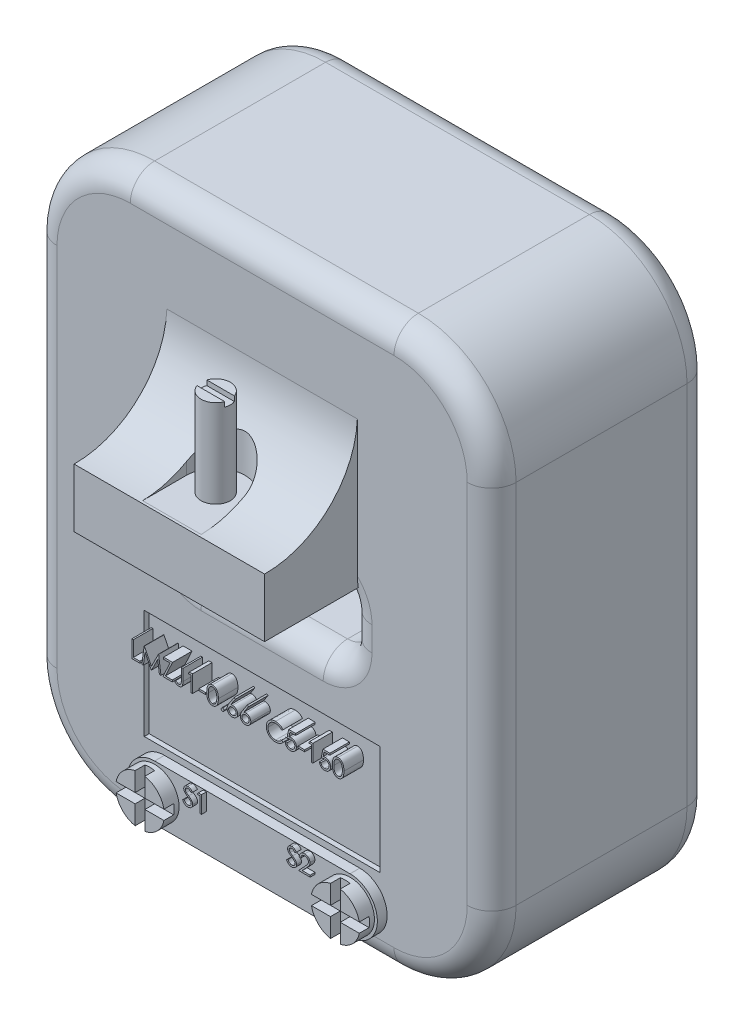
from build123d import *

# Parameters (mm, degrees)
EXTRUDE_1_DEPTH      = 45
FILLET_1_R           = 5
EXTRUDE_2_DEPTH      = 2
SKETCH_1_4_R         = 5
EXTRUDE_3_DEPTH      = 5
CUT_EXTRUDE_START    = 5
SKETCH_1_5_W         = 2
SKETCH_1_5_H         = 18.207670592
SKETCH_1_5_W_2       = 22.366156414
SKETCH_1_5_H_2       = 2
CUT_EXTRUDE_1_DEPTH  = 2
SKETCH_1_7_W         = 48.265395584
SKETCH_1_7_H         = 22.372697639
CUT_EXTRUDE_2_DEPTH  = 1
EXTRUDE_4_DEPTH      = 19.5
EXTRUDE_4_DEPTH_BACK = 19.5
CUT_EXTRUDE_START_2  = -12
CUT_EXTRUDE_3_DEPTH  = 39
EXTRUDE_5_DEPTH      = 6
EXTRUDE_5_DEPTH_BACK = 30
SKETCH_4_3_R         = 3
EXTRUDE_6_DEPTH      = 3
EXTRUDE_6_DEPTH_BACK = 1
SKETCH_5_W           = 1.346153846
SKETCH_5_H           = 0.358974359
CUT_EXTRUDE_START_3  = -30
SKETCH_4_4_W         = 9.536993714
SKETCH_4_4_H         = 2
CUT_EXTRUDE_4_DEPTH  = 1


with BuildPart() as part:
    # 草图1 → 凸台-拉伸1 (new body)
    with BuildSketch(Plane.XY):
        with BuildLine():
            Line((27, 57.5), (-27, 57.5))
            ThreePointArc((-27, 57.5), (-41.142135624, 51.642135624), (-47, 37.5))
            Line((-47, 37.5), (-47, -37.5))
            ThreePointArc((-47, -37.5), (-41.142135624, -51.642135624), (-27, -57.5))
            Line((-27, -57.5), (27, -57.5))
            ThreePointArc((27, -57.5), (41.142135624, -51.642135624), (47, -37.5))
            Line((47, -37.5), (47, 37.5))
            ThreePointArc((47, 37.5), (41.142135624, 51.642135624), (27, 57.5))
        make_face()
        with BuildLine():
            ThreePointArc((-17.5, 2.5), (-16.035533906, 6.035533906), (-12.5, 7.5))
            Line((-12.5, 7.5), (12.5, 7.5))
            ThreePointArc((12.5, 7.5), (16.035533906, 6.035533906), (17.5, 2.5))
            Line((17.5, 2.5), (17.5, -2.5))
            ThreePointArc((17.5, -2.5), (16.035533906, -6.035533906), (12.5, -7.5))
            Line((12.5, -7.5), (-12.5, -7.5))
            ThreePointArc((-12.5, -7.5), (-16.035533906, -6.035533906), (-17.5, -2.5))
            Line((-17.5, -2.5), (-17.5, 2.5))
        make_face(mode=Mode.SUBTRACT)
    extrude(amount=-EXTRUDE_1_DEPTH)

    # 圆角1
    fillet_1_edges = [part.edges().sort_by_distance(p)[0] for p in [
        (0, -7.5, -45),
        (-16.035533906, -6.035533906, -45),
        (-17.5, 0, -45),
        (-16.035533906, 6.035533906, -45),
        (0, 7.5, -45),
        (16.035533906, 6.035533906, -45),
        (17.5, 0, -45),
        (16.035533906, -6.035533906, -45),
        (0, 57.5, -45),
        (-41.142135624, 51.642135624, -45),
        (-47, 0, -45),
        (-41.142135624, -51.642135624, -45),
        (0, -57.5, -45),
        (41.142135624, -51.642135624, -45),
        (47, 0, -45),
        (41.142135624, 51.642135624, -45),
        (16.035533906, 6.035533906, 0),
        (0, 7.5, 0),
        (-16.035533906, 6.035533906, 0),
        (-17.5, 0, 0),
        (-16.035533906, -6.035533906, 0),
        (0, -7.5, 0),
        (16.035533906, -6.035533906, 0),
        (17.5, 0, 0),
        (47, 0, 0),
        (41.142135624, -51.642135624, 0),
        (0, -57.5, 0),
        (-41.142135624, -51.642135624, 0),
        (-47, 0, 0),
        (-41.142135624, 51.642135624, 0),
        (0, 57.5, 0),
        (41.142135624, 51.642135624, 0),
    ]]
    fillet(fillet_1_edges, radius=FILLET_1_R)

    # 草图1<3> → 凸台-拉伸2 (add)
    with BuildSketch(Plane.XY):
        with BuildLine():
            Line((-20, -41.9), (20, -41.9))
            ThreePointArc((20, -41.9), (25.6, -47.5), (20, -53.1))
            Line((20, -53.1), (-20, -53.1))
            ThreePointArc((-20, -53.1), (-25.6, -47.5), (-20, -41.9))
        make_face()
    extrude(amount=EXTRUDE_2_DEPTH)

    # 草图1<4> → 凸台-拉伸3 (add)
    with BuildSketch(Plane.XY):
        with Locations((20, -47.5)):
            Circle(SKETCH_1_4_R)
        with Locations((-20, -47.5)):
            Circle(SKETCH_1_4_R)
    extrude(amount=EXTRUDE_3_DEPTH)

    # 草图1<5> → 切除-拉伸1 (cut)
    with BuildSketch(Plane.XY.offset(CUT_EXTRUDE_START)):
        with Locations((-20, -47.5)):
            Rectangle(SKETCH_1_5_W, SKETCH_1_5_H)
        with Locations((20, -47.5)):
            Rectangle(SKETCH_1_5_W_2, SKETCH_1_5_H_2)
        with Locations((20, -47.5)):
            Rectangle(SKETCH_1_5_W, SKETCH_1_5_H)
        with Locations((-20, -47.5)):
            Rectangle(SKETCH_1_5_W_2, SKETCH_1_5_H_2)
    extrude(amount=-CUT_EXTRUDE_1_DEPTH, mode=Mode.SUBTRACT)

    # 草图1<7> → 切除-拉伸2 (cut)
    with BuildSketch(Plane.XY):
        with Locations((0, -29.436573144)):
            Rectangle(SKETCH_1_7_W, SKETCH_1_7_H)
    extrude(amount=-CUT_EXTRUDE_2_DEPTH, mode=Mode.SUBTRACT)

    # 草图3 → 凸台-拉伸4 (add, two sides: drawn at the far end of the back side and taken through both)
    with BuildSketch(Plane(origin=(0, 0, 0), x_dir=(0, 0, -1), z_dir=(1, 0, 0)).offset(-EXTRUDE_4_DEPTH_BACK)):
        with BuildLine():
            Line((-19, 7.5), (5, 7.5))
            ThreePointArc((5, 7.5), (1.464466094, 8.964466094), (0, 12.5))
            Line((0, 12.5), (0, 37.5))
            ThreePointArc((0, 37.5), (-5.840310888, 24.636994826), (-19, 19.5))
            Line((-19, 19.5), (-19, 7.5))
        make_face()
        with BuildLine():
            ThreePointArc((45, 12.5), (43.535533906, 8.964466094), (40, 7.5))
            Line((40, 7.5), (64, 7.5))
            Line((64, 7.5), (64, 19.5))
            ThreePointArc((64, 19.5), (50.840310888, 24.636994826), (45, 37.5))
            Line((45, 37.5), (45, 12.5))
        make_face()
    extrude(amount=EXTRUDE_4_DEPTH + EXTRUDE_4_DEPTH_BACK)

    # 草图4 → 切除-拉伸3 (cut)
    with BuildSketch(Plane.XZ.offset(-7.5).offset(CUT_EXTRUDE_START_2)):
        with BuildLine():
            Line((-6, 9.5), (-6, 29.074009548))
            Line((-6, 29.074009548), (6, 29.074009548))
            Line((6, 29.074009548), (6, 9.5))
            ThreePointArc((6, 9.5), (0, 3.5), (-6, 9.5))
        make_face()
        with BuildLine():
            Line((6, -74.074009548), (6, -54.5))
            ThreePointArc((6, -54.5), (0, -48.5), (-6, -54.5))
            Line((-6, -54.5), (-6, -74.074009548))
            Line((-6, -74.074009548), (6, -74.074009548))
        make_face()
    extrude(amount=-CUT_EXTRUDE_3_DEPTH, mode=Mode.SUBTRACT)

    # 草图4<3> → 凸台-拉伸5 (add, two sides: drawn at the far end of the back side and taken through both)
    with BuildSketch(Plane.XZ.offset(-7.5).offset(-EXTRUDE_5_DEPTH_BACK)):
        with Locations((0, 9.5)):
            Circle(SKETCH_4_3_R)
        with Locations((0, -54.5)):
            Circle(SKETCH_4_3_R)
    extrude(amount=EXTRUDE_5_DEPTH + EXTRUDE_5_DEPTH_BACK)

    # 草图5 → 凸台-拉伸6 (add, two sides: drawn at the far end of the back side and taken through both)
    # profile 1 of 20: a face of its own
    with BuildSketch(Plane.XY.offset(-EXTRUDE_6_DEPTH_BACK)):
        Polygon((-23.683979844, -21.583557658), (-23.369877279, -21.583557658), (-23.369877279, -24.724583299), (-22.023723433, -24.724583299), (-22.023723433, -25.083557658), (-23.683979844, -25.083557658), align=None)
    # profile 2 of 20: a face of its own
    with BuildSketch(Plane.XY.offset(-EXTRUDE_6_DEPTH_BACK)):
        Polygon((-21.619877279, -25.083557658), (-21.157838017, -21.583557658), (-21.112966222, -21.583557658), (-19.667954202, -24.455352529), (-18.226447792, -21.583557658), (-18.180874876, -21.583557658), (-17.716031126, -25.083557658), (-18.031535933, -25.083557658), (-18.366672151, -22.56512817), (-19.630093626, -25.083557658), (-19.700906927, -25.083557658), (-20.969236254, -22.559519196), (-21.30367135, -25.083557658), align=None)
    # profile 3 of 20: a face of its own
    with BuildSketch(Plane.XY.offset(-EXTRUDE_6_DEPTH_BACK)):
        Polygon((-17.177569587, -21.942532017), (-17.177569587, -21.583557658), (-15.337825997, -21.583557658), (-16.805975036, -24.724583299), (-15.382697792, -24.724583299), (-15.382697792, -25.083557658), (-17.312184972, -25.083557658), (-15.844035933, -21.942532017), align=None)
    # profile 4 of 20: a face of its own
    with BuildSketch(Plane.XY.offset(-EXTRUDE_6_DEPTH_BACK)):
        with BuildLine():
            Line((-13.542954202, -21.583557658), (-13.228851638, -21.583557658))
            Line((-13.228851638, -21.583557658), (-13.228851638, -23.947039228))
            add(Edge.make_bspline(
                [(-13.228851638, -23.947039228), (-13.229165557, -23.990744399), (-13.229768319, -24.07466366), (-13.23308273, -24.195537556), (-13.239216208, -24.305908242), (-13.24815122, -24.406026689), (-13.260071453, -24.495579245), (-13.273712481, -24.575257862), (-13.29022528, -24.644397545), (-13.315091746, -24.7220329), (-13.355865695, -24.807176705), (-13.417232733, -24.899131856), (-13.493465529, -24.979565266), (-13.581766562, -25.049417991), (-13.682907586, -25.105075223), (-13.794805806, -25.145030401), (-13.916772393, -25.169401258), (-14.001371605, -25.171975163), (-14.044957408, -25.173301247)],
                knots=[0, 0, 0, 0, 1.237770943, 2.376671248, 3.424123796, 4.367912054, 5.222547132, 5.982086412, 6.656319012, 7.234008312, 8.288027371, 9.317870876, 10.352700517, 11.413286737, 12.494591526, 13.606319346, 14.766767577, 16, 16, 16, 16], degree=3))
            add(Edge.make_bspline(
                [(-14.044957408, -25.173301247), (-14.078915766, -25.172220638), (-14.147242232, -25.170046381), (-14.248932941, -25.152324668), (-14.350334916, -25.125008625), (-14.451986365, -25.085006029), (-14.555895607, -25.030600431), (-14.663469953, -24.959415614), (-14.776093144, -24.871584088), (-14.85027643, -24.804546342), (-14.889108049, -24.769455093)],
                knots=[0, 0, 0, 0, 0.848567217, 1.707373443, 2.573483905, 3.470863513, 4.432650262, 5.500696352, 6.691726801, 8, 8, 8, 8], degree=3))
            Line((-14.889108049, -24.769455093), (-14.704011895, -24.500224324))
            add(Edge.make_bspline(
                [(-14.704011895, -24.500224324), (-14.661309216, -24.52967172), (-14.58068099, -24.585272244), (-14.462176549, -24.656798845), (-14.357179396, -24.71812401), (-14.288496448, -24.749376289), (-14.25669619, -24.763846119)],
                knots=[0, 0, 0, 0, 1.196737151, 2.259595785, 3.194191475, 4, 4, 4, 4], degree=3))
            add(Edge.make_bspline(
                [(-14.25669619, -24.763846119), (-14.237411878, -24.771405576), (-14.199591049, -24.786231356), (-14.141765969, -24.802777254), (-14.084270932, -24.811819664), (-14.046153238, -24.813500997), (-14.027429363, -24.814326888)],
                knots=[0, 0, 0, 0, 1.051806502, 2.062826769, 3.048436908, 4, 4, 4, 4], degree=3))
            add(Edge.make_bspline(
                [(-14.027429363, -24.814326888), (-14.003246574, -24.813304153), (-13.955446118, -24.811282584), (-13.885982124, -24.793433308), (-13.819524093, -24.766188905), (-13.758454435, -24.726297611), (-13.702169048, -24.678866191), (-13.655726222, -24.621510182), (-13.617008978, -24.557944198), (-13.593709285, -24.497772744), (-13.578864513, -24.442896114), (-13.569442886, -24.392462978), (-13.561204225, -24.3335015), (-13.554022673, -24.265941299), (-13.549818203, -24.189647117), (-13.54510093, -24.104842974), (-13.543395669, -24.011315062), (-13.543105848, -23.94610411), (-13.542954202, -23.911983138)],
                knots=[0, 0, 0, 0, 0.997221856, 1.971139923, 2.944579524, 3.951425367, 4.971190333, 5.972282193, 6.985401279, 8.033996657, 8.624075553, 9.332086008, 10.151144245, 11.082816738, 12.137127781, 13.306538797, 14.590673636, 16, 16, 16, 16], degree=3))
            Line((-13.542954202, -23.911983138), (-13.542954202, -21.583557658))
        make_face()
    # profile 5 of 20: a face of its own
    with BuildSketch(Plane.XY.offset(-EXTRUDE_6_DEPTH_BACK)):
        Polygon((-11.901628081, -21.583557658), (-11.254492664, -21.583557658), (-11.254492664, -25.083557658), (-11.568595228, -25.083557658), (-11.568595228, -21.942532017), (-12.107056767, -21.942532017), align=None)
    # profile 6 of 20: a face of its own
    with BuildSketch(Plane.XY.offset(-EXTRUDE_6_DEPTH_BACK)):
        with Locations((-9.28013369, -23.737403812)):
            Rectangle(SKETCH_5_W, SKETCH_5_H)
    # profile 7 of 20: a face of its own
    with BuildSketch(Plane.XY.offset(-EXTRUDE_6_DEPTH_BACK)):
        with BuildLine():
            add(Edge.make_bspline(
                [(-8.337825997, -23.334959901), (-8.337497979, -23.278862513), (-8.336860799, -23.169892529), (-8.329772378, -23.011107887), (-8.317997036, -22.862147598), (-8.301859663, -22.723004532), (-8.282221683, -22.593642768), (-8.256006196, -22.47440801), (-8.226193394, -22.364748404), (-8.191640948, -22.264306355), (-8.152653159, -22.171728652), (-8.110218898, -22.085303451), (-8.062654104, -22.005161519), (-8.012677191, -21.930023728), (-7.958265119, -21.861120033), (-7.900966329, -21.797477371), (-7.838544452, -21.74056662), (-7.773121444, -21.688720318), (-7.70410498, -21.643270846), (-7.633462314, -21.603238108), (-7.560707208, -21.569038241), (-7.485641025, -21.542147805), (-7.408938467, -21.519936958), (-7.3303314, -21.50474801), (-7.249690036, -21.495191102), (-7.195258602, -21.494277434), (-7.167653722, -21.493814068)],
                knots=[0, 0, 0, 0, 1.646270934, 3.197905019, 4.663502075, 6.030701355, 7.308322542, 8.50163776, 9.611534131, 10.641858119, 11.616356847, 12.558055219, 13.465016945, 14.349605745, 15.204443733, 16.039544428, 16.859896111, 17.680448484, 18.487036065, 19.28249412, 20.06191084, 20.843045899, 21.620316918, 22.403196591, 23.190181807, 24, 24, 24, 24], degree=3))
            add(Edge.make_bspline(
                [(-7.167653722, -21.493814068), (-7.139818243, -21.494301883), (-7.084462234, -21.495271994), (-7.002621859, -21.504595936), (-6.922672177, -21.52006706), (-6.844954039, -21.541988034), (-6.768829052, -21.569183711), (-6.694892645, -21.603270828), (-6.622685563, -21.642949695), (-6.553355275, -21.689573573), (-6.48614066, -21.741555849), (-6.422692697, -21.800318518), (-6.363005611, -21.865268237), (-6.306330306, -21.935710101), (-6.254274709, -22.012995186), (-6.204701276, -22.095779295), (-6.16032924, -22.18551016), (-6.117594565, -22.280690628), (-6.080707579, -22.383954287), (-6.047441333, -22.494719047), (-6.020562365, -22.614293234), (-5.998173092, -22.742049479), (-5.980828196, -22.878456963), (-5.968195554, -23.023223278), (-5.961522469, -23.176443669), (-5.960265768, -23.281201518), (-5.959620869, -23.334959901)],
                knots=[0, 0, 0, 0, 0.810914788, 1.612654377, 2.396697861, 3.181598691, 3.963628158, 4.749916497, 5.551656086, 6.361998678, 7.18212741, 8.025565596, 8.878627764, 9.750805457, 10.657531673, 11.591944965, 12.560506719, 13.57287815, 14.630710178, 15.753379473, 16.941251878, 18.199788006, 19.531962791, 20.947069417, 22.433333509, 24, 24, 24, 24], degree=3))
            add(Edge.make_bspline(
                [(-5.959620869, -23.334959901), (-5.960272454, -23.388483809), (-5.96154204, -23.492772961), (-5.968120746, -23.645303936), (-5.981079378, -23.78930198), (-5.997289366, -23.925112442), (-6.019740329, -24.052170061), (-6.047345495, -24.170914509), (-6.077995818, -24.281858581), (-6.115830612, -24.384093393), (-6.157241322, -24.479045115), (-6.202296519, -24.567712264), (-6.250566345, -24.650878556), (-6.30315509, -24.727878303), (-6.359208503, -24.79925696), (-6.419926292, -24.863754583), (-6.483596877, -24.922925255), (-6.551009293, -24.975576883), (-6.621420844, -25.021661687), (-6.693379921, -25.062875538), (-6.768163304, -25.096108233), (-6.844076257, -25.124643274), (-6.922204623, -25.146443726), (-7.002451014, -25.161517581), (-7.08440725, -25.172089429), (-7.139808815, -25.172895909), (-7.167653722, -25.173301247)],
                knots=[0, 0, 0, 0, 1.561518951, 3.042555995, 4.452378317, 5.7783523, 7.031515105, 8.214008947, 9.334062868, 10.386615937, 11.391082383, 12.354592575, 13.286541444, 14.194233754, 15.072674879, 15.931287219, 16.775624067, 17.606195743, 18.42308326, 19.229000347, 20.022332153, 20.807536673, 21.593273796, 22.3848459, 23.188221202, 24, 24, 24, 24], degree=3))
            add(Edge.make_bspline(
                [(-7.167653722, -25.173301247), (-7.195257836, -25.172834892), (-7.24968776, -25.17191533), (-7.330340186, -25.162401598), (-7.408622629, -25.147106095), (-7.484921383, -25.125689491), (-7.559627898, -25.099474655), (-7.631724185, -25.065320971), (-7.702011869, -25.025986902), (-7.770303425, -24.981191481), (-7.835315586, -24.929869798), (-7.897414191, -24.873105509), (-7.95503921, -24.809482098), (-8.008673306, -24.740004175), (-8.059647394, -24.665310932), (-8.106536767, -24.584382559), (-8.149907621, -24.497539949), (-8.189551112, -24.404222038), (-8.224699776, -24.30306711), (-8.255747484, -24.192917932), (-8.280261641, -24.072802296), (-8.301244597, -23.943684928), (-8.31816898, -23.805010998), (-8.329723305, -23.65670522), (-8.33686462, -23.498860011), (-8.33749969, -23.390590237), (-8.337825997, -23.334959901)],
                knots=[0, 0, 0, 0, 0.810891512, 1.598919785, 2.382837074, 3.152667961, 3.926044502, 4.706494248, 5.493654104, 6.291793342, 7.103789334, 7.925228297, 8.761435821, 9.622817696, 10.50288917, 11.416980706, 12.369136599, 13.353924996, 14.394355917, 15.514179734, 16.714354668, 17.994756427, 19.357759367, 20.818452758, 22.365282078, 24, 24, 24, 24], degree=3))
        make_face()
        with BuildLine():
            add(Edge.make_bspline(
                [(-8.023723433, -23.333557658), (-8.023603986, -23.380306356), (-8.023372163, -23.471036401), (-8.017315962, -23.602879662), (-8.00906573, -23.725849991), (-7.998424433, -23.840103527), (-7.982621485, -23.94525354), (-7.964914697, -24.042023223), (-7.943366607, -24.12990046), (-7.917871589, -24.209488271), (-7.888832492, -24.282137339), (-7.857126629, -24.349738554), (-7.823065906, -24.413090491), (-7.784946755, -24.471624099), (-7.743431692, -24.525530263), (-7.699458433, -24.575763096), (-7.651385849, -24.620560077), (-7.584882106, -24.674286932), (-7.497085632, -24.729806066), (-7.386465176, -24.778152156), (-7.272796725, -24.808534612), (-7.195645475, -24.812398368), (-7.157136895, -24.814326888)],
                knots=[0, 0, 0, 0, 1.459021318, 2.831673884, 4.118529203, 5.306027144, 6.411944654, 7.436330062, 8.375795394, 9.233974572, 10.042671642, 10.816086306, 11.563610507, 12.285937304, 12.993564865, 13.685989202, 14.367179055, 15.041617293, 16.353048772, 17.594441528, 18.799311195, 20, 20, 20, 20], degree=3))
            add(Edge.make_bspline(
                [(-7.157136895, -24.814326888), (-7.118379223, -24.812729108), (-7.0409439, -24.809536845), (-6.927810105, -24.778738107), (-6.817979835, -24.732268568), (-6.731907894, -24.677321062), (-6.666425351, -24.624992733), (-6.619508361, -24.580378085), (-6.576446312, -24.530422217), (-6.535604238, -24.476522921), (-6.498145162, -24.417650437), (-6.464082024, -24.354087862), (-6.432998677, -24.285658684), (-6.415289631, -24.237888945), (-6.406235452, -24.21346551)],
                knots=[0, 0, 0, 0, 1.353760809, 2.704726607, 4.075137775, 5.516104923, 6.260822281, 7.007110065, 7.778089737, 8.566572457, 9.372053459, 10.217411131, 11.088608312, 12, 12, 12, 12], degree=3))
            add(Edge.make_bspline(
                [(-6.406235452, -24.21346551), (-6.395683685, -24.182235771), (-6.374259071, -24.118826006), (-6.346647297, -24.020462354), (-6.324901897, -23.91725959), (-6.305338532, -23.809834474), (-6.291985476, -23.697394773), (-6.281237662, -23.580288389), (-6.274906976, -23.458427027), (-6.274122224, -23.375632035), (-6.273723433, -23.333557658)],
                knots=[0, 0, 0, 0, 0.884706709, 1.796334032, 2.740027952, 3.714592787, 4.726048262, 5.777819803, 6.87074269, 8, 8, 8, 8], degree=3))
            add(Edge.make_bspline(
                [(-6.273723433, -23.333557658), (-6.274273622, -23.291490085), (-6.27534991, -23.20919692), (-6.279463898, -23.08867874), (-6.290087472, -22.974210979), (-6.301886591, -22.865300506), (-6.319283812, -22.762550203), (-6.338041619, -22.665099898), (-6.363242832, -22.574156873), (-6.390162607, -22.488297292), (-6.420973002, -22.408496637), (-6.454888736, -22.334382851), (-6.491110495, -22.265598126), (-6.530452736, -22.202331184), (-6.572448419, -22.144298641), (-6.618205968, -22.092664047), (-6.665910341, -22.045827079), (-6.732727526, -21.99236451), (-6.820201816, -21.937852814), (-6.929047464, -21.887687054), (-7.042318108, -21.858878762), (-7.118891562, -21.854817075), (-7.157136895, -21.852788427)],
                knots=[0, 0, 0, 0, 1.31362396, 2.569729283, 3.763502607, 4.902122613, 5.988968491, 7.01645872, 7.998833611, 8.933434873, 9.825090667, 10.667526885, 11.477055099, 12.250526234, 12.991942729, 13.710640831, 14.402115721, 15.076753259, 16.378508321, 17.609869233, 18.806226677, 20, 20, 20, 20], degree=3))
            add(Edge.make_bspline(
                [(-7.157136895, -21.852788427), (-7.195847487, -21.854819873), (-7.273339192, -21.858886468), (-7.387787147, -21.887579721), (-7.497491499, -21.937592687), (-7.584734474, -21.99254506), (-7.65159826, -22.044883371), (-7.698680953, -22.090269825), (-7.742827126, -22.139916079), (-7.783494826, -22.194317994), (-7.821584109, -22.252783362), (-7.856565122, -22.315772126), (-7.888082451, -22.383603491), (-7.917166987, -22.456219926), (-7.942739775, -22.53580087), (-7.963833739, -22.623569864), (-7.983320792, -22.720031756), (-7.997116061, -22.825751264), (-8.009379816, -22.940033417), (-8.017261164, -23.063310735), (-8.023392422, -23.195375116), (-8.023610886, -23.286574274), (-8.023723433, -23.333557658)],
                knots=[0, 0, 0, 0, 1.207732386, 2.417664972, 3.655092373, 4.956220595, 5.625982001, 6.301752483, 6.994047911, 7.697131622, 8.419323945, 9.170223765, 9.943494443, 10.752040957, 11.610060368, 12.549350801, 13.567764191, 14.679664412, 15.874934091, 17.154273443, 18.533957287, 20, 20, 20, 20], degree=3))
        make_face(mode=Mode.SUBTRACT)
    # profile 8 of 20: a face of its own
    with BuildSketch(Plane.XY.offset(-EXTRUDE_6_DEPTH_BACK)):
        with BuildLine():
            add(Edge.make_bspline(
                [(-5.084620869, -24.545096119), (-5.065130657, -24.546254286), (-5.026922375, -24.548524736), (-4.971683246, -24.56410141), (-4.921688587, -24.59176007), (-4.877156342, -24.628622849), (-4.840449865, -24.673318512), (-4.811805513, -24.722914421), (-4.796364528, -24.778616013), (-4.794110616, -24.817045688), (-4.792954202, -24.836762786)],
                knots=[0, 0, 0, 0, 1.020151414, 1.999887582, 2.974338812, 3.990962822, 5.007586832, 5.987933904, 6.967670073, 8, 8, 8, 8], degree=3))
            add(Edge.make_bspline(
                [(-4.792954202, -24.836762786), (-4.794149803, -24.856006116), (-4.79650751, -24.893953679), (-4.811770118, -24.949235142), (-4.840668169, -24.998862046), (-4.876903162, -25.044164184), (-4.921699595, -25.081105055), (-4.971801442, -25.1085284), (-5.0267927, -25.12522038), (-5.065109023, -25.127346677), (-5.084620869, -25.128429452)],
                knots=[0, 0, 0, 0, 1.009421747, 1.99056486, 2.972319754, 3.999869655, 5.017953583, 5.993804169, 6.978383603, 8, 8, 8, 8], degree=3))
            add(Edge.make_bspline(
                [(-5.084620869, -25.128429452), (-5.104146775, -25.127385855), (-5.142266457, -25.12534848), (-5.197052452, -25.108185674), (-5.24745942, -25.081362214), (-5.292247132, -25.044095304), (-5.328785604, -24.999095161), (-5.356410986, -24.948893364), (-5.373001135, -24.894111927), (-5.375183008, -24.856037284), (-5.376287536, -24.836762786)],
                knots=[0, 0, 0, 0, 1.022052826, 1.995314843, 2.982371812, 4.00089066, 5.028879526, 6.005146991, 6.990147033, 8, 8, 8, 8], degree=3))
            add(Edge.make_bspline(
                [(-5.376287536, -24.836762786), (-5.375225437, -24.817013406), (-5.373151818, -24.778455166), (-5.356376158, -24.723256059), (-5.328999946, -24.673087619), (-5.291994551, -24.628691039), (-5.247470255, -24.591503737), (-5.19717405, -24.564438943), (-5.14213451, -24.548398531), (-5.104124571, -24.546216015), (-5.084620869, -24.545096119)],
                knots=[0, 0, 0, 0, 1.032775665, 2.016367738, 2.991239715, 4.008302682, 5.025365648, 6.011011707, 6.979408107, 8, 8, 8, 8], degree=3))
        make_face()
    # profile 9 of 20: a face of its own
    with BuildSketch(Plane.XY.offset(-EXTRUDE_6_DEPTH_BACK)):
        with BuildLine():
            Line((-2.728851638, -21.493814068), (-2.486964619, -21.683818074))
            Line((-2.486964619, -21.683818074), (-3.411744267, -23.097980734))
            add(Edge.make_bspline(
                [(-3.411744267, -23.097980734), (-3.35017399, -23.088166874), (-3.230074203, -23.069023829), (-3.108508304, -23.065865884), (-3.049264299, -23.064326888)],
                knots=[0, 0, 0, 0, 1.025318673, 2, 2, 2, 2], degree=3))
            add(Edge.make_bspline(
                [(-3.049264299, -23.064326888), (-3.013691802, -23.065283), (-2.943668402, -23.067165077), (-2.8408616, -23.081648928), (-2.742072664, -23.10447404), (-2.647711051, -23.137746296), (-2.55743807, -23.18024865), (-2.470735673, -23.231187521), (-2.389233663, -23.293193201), (-2.311882484, -23.362458157), (-2.241655387, -23.439175141), (-2.179479331, -23.520576478), (-2.127252539, -23.606577359), (-2.084878618, -23.697134225), (-2.051973739, -23.792107484), (-2.027986094, -23.891375624), (-2.013806501, -23.995007095), (-2.011881011, -24.065485271), (-2.01090292, -24.101286023)],
                knots=[0, 0, 0, 0, 1.04369286, 2.054478336, 3.041073146, 4.015093852, 4.984733326, 5.965804835, 6.960378782, 7.985147595, 9.009457201, 10.008161701, 10.986880575, 11.956520048, 12.937015923, 13.931873656, 14.949455224, 16, 16, 16, 16], degree=3))
            add(Edge.make_bspline(
                [(-2.01090292, -24.101286023), (-2.012326025, -24.150265727), (-2.015126359, -24.246646193), (-2.043030155, -24.387022899), (-2.0863898, -24.520755415), (-2.148367328, -24.645708586), (-2.225349711, -24.761711156), (-2.319227304, -24.864496621), (-2.426670792, -24.956166658), (-2.54815759, -25.032823278), (-2.678900554, -25.095426329), (-2.816252552, -25.140391571), (-2.958879698, -25.16807504), (-3.055684306, -25.171545643), (-3.10465292, -25.173301247)],
                knots=[0, 0, 0, 0, 1.031375318, 2.029502543, 3.004789286, 3.987476834, 4.960371455, 5.9300674, 6.912260825, 7.929083631, 8.949397511, 9.960523116, 10.96833055, 12, 12, 12, 12], degree=3))
            add(Edge.make_bspline(
                [(-3.10465292, -25.173301247), (-3.151749621, -25.171773042), (-3.245039939, -25.168745934), (-3.382272733, -25.141779996), (-3.514135751, -25.098072893), (-3.639705132, -25.037858614), (-3.756025745, -24.961800731), (-3.860091381, -24.870238452), (-3.951383156, -24.765128987), (-4.027357776, -24.64648864), (-4.087616508, -24.518998682), (-4.132806434, -24.386061526), (-4.159202677, -24.248161544), (-4.162891234, -24.154680405), (-4.164749074, -24.107596119)],
                knots=[0, 0, 0, 0, 1.012016664, 2.004627821, 2.994792927, 3.992885782, 4.990978636, 5.973936114, 6.964471063, 7.975201453, 8.993600317, 9.990122807, 10.98767138, 12, 12, 12, 12], degree=3))
            add(Edge.make_bspline(
                [(-4.164749074, -24.107596119), (-4.163567629, -24.071551536), (-4.161155344, -23.997955384), (-4.144311954, -23.886491356), (-4.117247159, -23.772440274), (-4.086936913, -23.675686081), (-4.054911303, -23.596424559), (-4.028258763, -23.532521068), (-3.995084767, -23.466759995), (-3.959711386, -23.396886359), (-3.918954517, -23.324700926), (-3.874638868, -23.248997257), (-3.825539217, -23.170979329), (-3.791119054, -23.118035134), (-3.773523113, -23.090969517)],
                knots=[0, 0, 0, 0, 1.173818275, 2.396712641, 3.66331629, 4.989737886, 5.693666774, 6.447286557, 7.243889047, 8.091586357, 8.998013824, 9.943181721, 10.948533338, 12, 12, 12, 12], degree=3))
            Line((-3.773523113, -23.090969517), (-2.728851638, -21.493814068))
        make_face()
        with BuildLine():
            add(Edge.make_bspline(
                [(-3.115169747, -23.423301247), (-3.141831992, -23.424079291), (-3.193911102, -23.425599036), (-3.270318516, -23.434424288), (-3.342631768, -23.451043354), (-3.411808901, -23.472209686), (-3.476556604, -23.501312746), (-3.537345444, -23.536664544), (-3.594410496, -23.578285723), (-3.647154048, -23.625586634), (-3.694973711, -23.677374667), (-3.736154842, -23.732844189), (-3.771677242, -23.790658392), (-3.800559061, -23.851300334), (-3.823049137, -23.914746834), (-3.839317388, -23.980706083), (-3.848371139, -24.049620389), (-3.84987737, -24.096352892), (-3.85064651, -24.120216311)],
                knots=[0, 0, 0, 0, 1.129588631, 2.206414736, 3.251139165, 4.268635594, 5.265702196, 6.250456724, 7.242448911, 8.251968645, 9.246821453, 10.222880186, 11.173611482, 12.116736599, 13.062300278, 14.020270554, 14.989073742, 16, 16, 16, 16], degree=3))
            add(Edge.make_bspline(
                [(-3.85064651, -24.120216311), (-3.850020149, -24.143866291), (-3.848791947, -24.190240381), (-3.837639627, -24.258579561), (-3.820604545, -24.324344469), (-3.795264149, -24.387196068), (-3.765037261, -24.448092386), (-3.725131937, -24.504827671), (-3.680915151, -24.560847741), (-3.628061217, -24.611849213), (-3.571337854, -24.659305837), (-3.510736652, -24.700786091), (-3.447576692, -24.736272264), (-3.38100527, -24.764083362), (-3.311966886, -24.786907648), (-3.239886332, -24.802969128), (-3.164713476, -24.812049654), (-3.113791538, -24.813557847), (-3.087825997, -24.814326888)],
                knots=[0, 0, 0, 0, 0.989467248, 1.94019797, 2.891935182, 3.827694429, 4.772920941, 5.730924762, 6.725747692, 7.756678648, 8.79901574, 9.819492441, 10.826891316, 11.826466727, 12.835195252, 13.867842842, 14.912794438, 16, 16, 16, 16], degree=3))
            add(Edge.make_bspline(
                [(-3.087825997, -24.814326888), (-3.061860499, -24.813557787), (-3.010938644, -24.812049475), (-2.935765184, -24.802969806), (-2.863686865, -24.786905158), (-2.794640357, -24.764092388), (-2.728098926, -24.736238778), (-2.664994204, -24.701006859), (-2.604966111, -24.659050741), (-2.548205511, -24.611930313), (-2.495571573, -24.560557461), (-2.450294294, -24.505327738), (-2.411611061, -24.447633843), (-2.380176874, -24.387435953), (-2.355115582, -24.324306466), (-2.337994115, -24.258589742), (-2.326864826, -24.190237716), (-2.32563346, -24.143865391), (-2.325005485, -24.120216311)],
                knots=[0, 0, 0, 0, 1.087397944, 2.132534446, 3.165364764, 4.174271784, 5.174024072, 6.181601208, 7.194203697, 8.236725232, 9.267838612, 10.269026844, 11.221737037, 12.171628256, 13.107553087, 14.05945871, 15.010357665, 16, 16, 16, 16], degree=3))
            add(Edge.make_bspline(
                [(-2.325005485, -24.120216311), (-2.325555778, -24.09632176), (-2.326635824, -24.049424528), (-2.338851772, -23.98073691), (-2.355794146, -23.914411704), (-2.381377177, -23.850865754), (-2.414613722, -23.790349827), (-2.455097129, -23.732558226), (-2.501929699, -23.677047879), (-2.556027239, -23.625485071), (-2.614917473, -23.578337993), (-2.677533058, -23.536718436), (-2.743041032, -23.50159346), (-2.811374974, -23.472286357), (-2.883317857, -23.451136883), (-2.957708196, -23.43448364), (-3.035497438, -23.425621622), (-3.088274047, -23.424084557), (-3.115169747, -23.423301247)],
                knots=[0, 0, 0, 0, 0.978206639, 1.919901502, 2.851605144, 3.780102724, 4.718870031, 5.675451981, 6.667674623, 7.690630536, 8.733308323, 9.756129687, 10.767539656, 11.776269907, 12.797430371, 13.836405707, 14.897401972, 16, 16, 16, 16], degree=3))
        make_face(mode=Mode.SUBTRACT)
    # profile 10 of 20: a face of its own
    with BuildSketch(Plane.XY.offset(-EXTRUDE_6_DEPTH_BACK)):
        with BuildLine():
            Line((-0.036543946, -21.493814068), (0.205343073, -21.683818074))
            Line((0.205343073, -21.683818074), (-0.719436574, -23.097980734))
            add(Edge.make_bspline(
                [(-0.719436574, -23.097980734), (-0.657866297, -23.088166874), (-0.537766511, -23.069023829), (-0.416200612, -23.065865884), (-0.356956606, -23.064326888)],
                knots=[0, 0, 0, 0, 1.025318673, 2, 2, 2, 2], degree=3))
            add(Edge.make_bspline(
                [(-0.356956606, -23.064326888), (-0.32138411, -23.065283), (-0.25136071, -23.067165077), (-0.148553907, -23.081648928), (-0.049764971, -23.10447404), (0.044596641, -23.137746296), (0.134869623, -23.18024865), (0.221572019, -23.231187521), (0.303074029, -23.293193201), (0.380425208, -23.362458157), (0.450652306, -23.439175141), (0.512828361, -23.520576478), (0.565055153, -23.606577359), (0.607429074, -23.697134225), (0.640333953, -23.792107484), (0.664321598, -23.891375624), (0.678501191, -23.995007095), (0.680426682, -24.065485271), (0.681404772, -24.101286023)],
                knots=[0, 0, 0, 0, 1.04369286, 2.054478336, 3.041073146, 4.015093852, 4.984733326, 5.965804835, 6.960378782, 7.985147595, 9.009457201, 10.008161701, 10.986880575, 11.956520048, 12.937015923, 13.931873656, 14.949455224, 16, 16, 16, 16], degree=3))
            add(Edge.make_bspline(
                [(0.681404772, -24.101286023), (0.679981667, -24.150265727), (0.677181333, -24.246646193), (0.649277537, -24.387022899), (0.605917893, -24.520755415), (0.543940364, -24.645708586), (0.466957981, -24.761711156), (0.373080389, -24.864496621), (0.2656369, -24.956166658), (0.144150102, -25.032823278), (0.013407138, -25.095426329), (-0.12394486, -25.140391571), (-0.266572006, -25.16807504), (-0.363376614, -25.171545643), (-0.412345228, -25.173301247)],
                knots=[0, 0, 0, 0, 1.031375318, 2.029502543, 3.004789286, 3.987476834, 4.960371455, 5.9300674, 6.912260825, 7.929083631, 8.949397511, 9.960523116, 10.96833055, 12, 12, 12, 12], degree=3))
            add(Edge.make_bspline(
                [(-0.412345228, -25.173301247), (-0.459441929, -25.171773042), (-0.552732247, -25.168745934), (-0.689965041, -25.141779996), (-0.821828058, -25.098072893), (-0.947397439, -25.037858614), (-1.063718052, -24.961800731), (-1.167783689, -24.870238452), (-1.259075463, -24.765128987), (-1.335050084, -24.64648864), (-1.395308816, -24.518998682), (-1.440498741, -24.386061526), (-1.466894984, -24.248161544), (-1.470583541, -24.154680405), (-1.472441382, -24.107596119)],
                knots=[0, 0, 0, 0, 1.012016664, 2.004627821, 2.994792927, 3.992885782, 4.990978636, 5.973936114, 6.964471063, 7.975201453, 8.993600317, 9.990122807, 10.98767138, 12, 12, 12, 12], degree=3))
            add(Edge.make_bspline(
                [(-1.472441382, -24.107596119), (-1.471259937, -24.071551536), (-1.468847652, -23.997955384), (-1.452004262, -23.886491356), (-1.424939467, -23.772440274), (-1.394629221, -23.675686081), (-1.36260361, -23.596424559), (-1.335951071, -23.532521068), (-1.302777075, -23.466759995), (-1.267403694, -23.396886359), (-1.226646825, -23.324700926), (-1.182331175, -23.248997257), (-1.133231524, -23.170979329), (-1.098811362, -23.118035134), (-1.08121542, -23.090969517)],
                knots=[0, 0, 0, 0, 1.173818275, 2.396712641, 3.66331629, 4.989737886, 5.693666774, 6.447286557, 7.243889047, 8.091586357, 8.998013824, 9.943181721, 10.948533338, 12, 12, 12, 12], degree=3))
            Line((-1.08121542, -23.090969517), (-0.036543946, -21.493814068))
        make_face()
        with BuildLine():
            add(Edge.make_bspline(
                [(-0.422862055, -23.423301247), (-0.4495243, -23.424079291), (-0.501603409, -23.425599036), (-0.578010824, -23.434424288), (-0.650324075, -23.451043354), (-0.719501209, -23.472209686), (-0.784248912, -23.501312746), (-0.845037752, -23.536664544), (-0.902102804, -23.578285723), (-0.954846355, -23.625586634), (-1.002666019, -23.677374667), (-1.04384715, -23.732844189), (-1.07936955, -23.790658392), (-1.108251369, -23.851300334), (-1.130741444, -23.914746834), (-1.147009695, -23.980706083), (-1.156063446, -24.049620389), (-1.157569678, -24.096352892), (-1.158338818, -24.120216311)],
                knots=[0, 0, 0, 0, 1.129588631, 2.206414736, 3.251139165, 4.268635594, 5.265702196, 6.250456724, 7.242448911, 8.251968645, 9.246821453, 10.222880186, 11.173611482, 12.116736599, 13.062300278, 14.020270554, 14.989073742, 16, 16, 16, 16], degree=3))
            add(Edge.make_bspline(
                [(-1.158338818, -24.120216311), (-1.157712456, -24.143866291), (-1.156484255, -24.190240381), (-1.145331935, -24.258579561), (-1.128296853, -24.324344469), (-1.102956457, -24.387196068), (-1.072729569, -24.448092386), (-1.032824244, -24.504827671), (-0.988607459, -24.560847741), (-0.935753525, -24.611849213), (-0.879030162, -24.659305837), (-0.81842896, -24.700786091), (-0.755269, -24.736272264), (-0.688697578, -24.764083362), (-0.619659194, -24.786907648), (-0.54757864, -24.802969128), (-0.472405784, -24.812049654), (-0.421483846, -24.813557847), (-0.395518305, -24.814326888)],
                knots=[0, 0, 0, 0, 0.989467248, 1.94019797, 2.891935182, 3.827694429, 4.772920941, 5.730924762, 6.725747692, 7.756678648, 8.79901574, 9.819492441, 10.826891316, 11.826466727, 12.835195252, 13.867842842, 14.912794438, 16, 16, 16, 16], degree=3))
            add(Edge.make_bspline(
                [(-0.395518305, -24.814326888), (-0.369552807, -24.813557787), (-0.318630952, -24.812049475), (-0.243457492, -24.802969806), (-0.171379173, -24.786905158), (-0.102332664, -24.764092388), (-0.035791233, -24.736238778), (0.027313488, -24.701006859), (0.087341582, -24.659050741), (0.144102181, -24.611930313), (0.19673612, -24.560557461), (0.242013398, -24.505327738), (0.280696632, -24.447633843), (0.312130819, -24.387435953), (0.33719211, -24.324306466), (0.354313577, -24.258589742), (0.365442866, -24.190237716), (0.366674232, -24.143865391), (0.367302208, -24.120216311)],
                knots=[0, 0, 0, 0, 1.087397944, 2.132534446, 3.165364764, 4.174271784, 5.174024072, 6.181601208, 7.194203697, 8.236725232, 9.267838612, 10.269026844, 11.221737037, 12.171628256, 13.107553087, 14.05945871, 15.010357665, 16, 16, 16, 16], degree=3))
            add(Edge.make_bspline(
                [(0.367302208, -24.120216311), (0.366751915, -24.09632176), (0.365671869, -24.049424528), (0.35345592, -23.98073691), (0.336513546, -23.914411704), (0.310930515, -23.850865754), (0.277693971, -23.790349827), (0.237210564, -23.732558226), (0.190377993, -23.677047879), (0.136280454, -23.625485071), (0.07739022, -23.578337993), (0.014774634, -23.536718436), (-0.050733339, -23.50159346), (-0.119067282, -23.472286357), (-0.191010164, -23.451136883), (-0.265400504, -23.43448364), (-0.343189746, -23.425621622), (-0.395966355, -23.424084557), (-0.422862055, -23.423301247)],
                knots=[0, 0, 0, 0, 0.978206639, 1.919901502, 2.851605144, 3.780102724, 4.718870031, 5.675451981, 6.667674623, 7.690630536, 8.733308323, 9.756129687, 10.767539656, 11.776269907, 12.797430371, 13.836405707, 14.897401972, 16, 16, 16, 16], degree=3))
        make_face(mode=Mode.SUBTRACT)
    # profile 11 of 20: a face of its own
    with BuildSketch(Plane.XY.offset(-EXTRUDE_6_DEPTH_BACK)):
        with BuildLine():
            Line((7.277558618, -22.225785222), (7.002718874, -22.43612176))
            add(Edge.make_bspline(
                [(7.002718874, -22.43612176), (6.983112986, -22.41275579), (6.944165539, -22.366338875), (6.881506337, -22.30115933), (6.816204694, -22.240094069), (6.748285573, -22.182852189), (6.676526453, -22.131435423), (6.602665654, -22.08316432), (6.525467609, -22.039896582), (6.418715875, -21.987433596), (6.279068026, -21.932687441), (6.103273187, -21.88678421), (5.919762089, -21.857563034), (5.794564489, -21.854398193), (5.730883939, -21.852788427)],
                knots=[0, 0, 0, 0, 0.757959112, 1.505699292, 2.245454638, 2.979532153, 3.711538275, 4.438200793, 5.171680507, 5.909471876, 7.393775596, 8.890124382, 10.418191784, 12, 12, 12, 12], degree=3))
            add(Edge.make_bspline(
                [(5.730883939, -21.852788427), (5.695800639, -21.853192389), (5.625959647, -21.853996565), (5.522311173, -21.86460569), (5.420598122, -21.8795169), (5.320886656, -21.901642224), (5.223303697, -21.929614843), (5.127211295, -21.963040257), (5.034000695, -22.004395097), (4.942382457, -22.050103356), (4.854603246, -22.101730801), (4.771548198, -22.158044153), (4.69352023, -22.21841325), (4.620457618, -22.283064356), (4.55228567, -22.351706316), (4.489498359, -22.425070658), (4.432312949, -22.502922831), (4.379595924, -22.584236239), (4.332383191, -22.668774031), (4.292853311, -22.756849101), (4.257848189, -22.846953204), (4.230148946, -22.940104365), (4.208224429, -23.035647131), (4.193096766, -23.133837919), (4.182608295, -23.234471598), (4.181808118, -23.302680911), (4.181404772, -23.337063267)],
                knots=[0, 0, 0, 0, 1.054917814, 2.100044995, 3.131103042, 4.146048494, 5.169673617, 6.183595914, 7.203665975, 8.234915748, 9.262203917, 10.264457458, 11.251630812, 12.227803204, 13.197192746, 14.159520551, 15.12972552, 16.100847026, 17.073214652, 18.039054194, 19.002613845, 19.979014051, 20.95965708, 21.949030935, 22.966165397, 24, 24, 24, 24], degree=3))
            add(Edge.make_bspline(
                [(4.181404772, -23.337063267), (4.182666591, -23.388794586), (4.185144005, -23.490362171), (4.207192339, -23.639132782), (4.240697431, -23.781653456), (4.290913007, -23.917033298), (4.352832058, -24.046941656), (4.43107267, -24.169180509), (4.521689207, -24.285597074), (4.625963626, -24.393440022), (4.740369442, -24.491953747), (4.863117354, -24.578704328), (4.993901642, -24.651019211), (5.131278272, -24.711195157), (5.276304386, -24.757451885), (5.428719188, -24.790016009), (5.588191184, -24.811258189), (5.697160583, -24.813291877), (5.752618714, -24.814326888)],
                knots=[0, 0, 0, 0, 1.029171465, 2.020641659, 2.987623507, 3.938342917, 4.889210282, 5.84687017, 6.821220943, 7.821438502, 8.827599549, 9.822697543, 10.807740252, 11.797342354, 12.80366471, 13.83203677, 14.896651826, 16, 16, 16, 16], degree=3))
            add(Edge.make_bspline(
                [(5.752618714, -24.814326888), (5.813721403, -24.812638109), (5.933986112, -24.809314186), (6.110354138, -24.781154937), (6.279189904, -24.735497019), (6.440502491, -24.671599097), (6.593837137, -24.588533809), (6.739433797, -24.487835931), (6.877415368, -24.368547599), (6.96038665, -24.27746447), (7.002718874, -24.230993555)],
                knots=[0, 0, 0, 0, 1.028121516, 2.023589091, 2.998037872, 3.967518031, 4.937445131, 5.927275754, 6.942489185, 8, 8, 8, 8], degree=3))
            Line((7.002718874, -24.230993555), (7.277558618, -24.439226728))
            add(Edge.make_bspline(
                [(7.277558618, -24.439226728), (7.255440508, -24.46776518), (7.211310233, -24.524705386), (7.139852216, -24.604977096), (7.064574918, -24.680481132), (6.984919208, -24.750608753), (6.901801417, -24.816763218), (6.813729105, -24.87706505), (6.721860072, -24.932355934), (6.626505593, -24.982982858), (6.52776698, -25.027900105), (6.425762545, -25.066353873), (6.32093197, -25.099478763), (6.213270461, -25.126730699), (6.102554705, -25.148001783), (5.989184231, -25.162221458), (5.872914355, -25.171963373), (5.794472934, -25.172851288), (5.75472208, -25.173301247)],
                knots=[0, 0, 0, 0, 0.986787822, 1.968848986, 2.935600012, 3.899624008, 4.868462664, 5.837806735, 6.815139263, 7.798259679, 8.787526145, 9.778297419, 10.776456485, 11.791383307, 12.812564526, 13.85620153, 14.913611965, 16, 16, 16, 16], degree=3))
            add(Edge.make_bspline(
                [(5.75472208, -25.173301247), (5.717078413, -25.173039255), (5.642642722, -25.172521197), (5.532743971, -25.16412903), (5.42575439, -25.152679293), (5.321979764, -25.135439162), (5.220853789, -25.115094821), (5.123293205, -25.087823565), (5.028337994, -25.057274398), (4.936369654, -25.021369412), (4.847309954, -24.980853229), (4.761446142, -24.93506167), (4.67881771, -24.884379805), (4.598612289, -24.829924795), (4.522014705, -24.769947493), (4.44836118, -24.705280859), (4.377238704, -24.636142848), (4.333236019, -24.586287995), (4.311112304, -24.56122192)],
                knots=[0, 0, 0, 0, 1.114604814, 2.203992996, 3.262667896, 4.300477797, 5.318619304, 6.316056647, 7.298880507, 8.271930387, 9.238335007, 10.195173496, 11.151986948, 12.108099108, 13.064862484, 14.031167946, 15.010108607, 16, 16, 16, 16], degree=3))
            add(Edge.make_bspline(
                [(4.311112304, -24.56122192), (4.27567666, -24.517680731), (4.205233184, -24.431124021), (4.1151075, -24.29083804), (4.037959945, -24.144369831), (3.975584024, -23.990949902), (3.926821291, -23.830922515), (3.893040096, -23.664207001), (3.871088491, -23.490959058), (3.868578203, -23.37312227), (3.867302208, -23.313225126)],
                knots=[0, 0, 0, 0, 0.994628077, 1.977248131, 2.950237994, 3.925870899, 4.908910175, 5.911660606, 6.938484602, 8, 8, 8, 8], degree=3))
            add(Edge.make_bspline(
                [(3.867302208, -23.313225126), (3.868857401, -23.250269672), (3.871917148, -23.126408747), (3.897912943, -22.944634794), (3.939731739, -22.770483395), (3.999128628, -22.604279651), (4.074433979, -22.44514937), (4.167460593, -22.294308166), (4.277127735, -22.150791366), (4.402575303, -22.016776615), (4.540142638, -21.894237262), (4.687461452, -21.786431058), (4.844243399, -21.696713542), (5.008761251, -21.62171738), (5.182246932, -21.564072917), (5.364330301, -21.52371973), (5.554669216, -21.498602614), (5.684531642, -21.495427406), (5.750515349, -21.493814068)],
                knots=[0, 0, 0, 0, 1.032925535, 2.032216505, 3.007276963, 3.968222605, 4.92396291, 5.891752235, 6.871517503, 7.883894988, 8.900124299, 9.891468569, 10.874487609, 11.85992873, 12.854644235, 13.869047385, 14.917252991, 16, 16, 16, 16], degree=3))
            add(Edge.make_bspline(
                [(5.750515349, -21.493814068), (5.790729821, -21.494296206), (5.870330318, -21.49525055), (5.98808297, -21.504556692), (6.102725297, -21.520070298), (6.214336279, -21.541186368), (6.323458896, -21.56739369), (6.429259137, -21.601533988), (6.532357823, -21.640570519), (6.632104732, -21.685528985), (6.728021282, -21.735995727), (6.8200776, -21.79141135), (6.907542459, -21.851707156), (6.991031307, -21.916370331), (7.069147518, -21.98676889), (7.144108997, -22.060966486), (7.213370075, -22.14110031), (7.25612327, -22.197505244), (7.277558618, -22.225785222)],
                knots=[0, 0, 0, 0, 1.096760587, 2.17092713, 3.219439832, 4.250915756, 5.268269357, 6.278326846, 7.281116186, 8.274029601, 9.260640565, 10.235837813, 11.203064059, 12.156899882, 13.114053108, 14.069676657, 15.032185724, 16, 16, 16, 16], degree=3))
        make_face()
    # profile 12 of 20: a face of its own
    with BuildSketch(Plane.XY.offset(-EXTRUDE_6_DEPTH_BACK)):
        with BuildLine():
            Line((9.880122721, -21.583557658), (9.880122721, -21.942532017))
            Line((9.880122721, -21.942532017), (8.689617913, -21.942532017))
            Line((8.689617913, -21.942532017), (8.50101615, -22.863104933))
            add(Edge.make_bspline(
                [(8.50101615, -22.863104933), (8.538072024, -22.852874661), (8.60986192, -22.833055128), (8.715821781, -22.811049357), (8.816413985, -22.797783913), (8.881689355, -22.795972603), (8.913275765, -22.795096119)],
                knots=[0, 0, 0, 0, 1.100273476, 2.13160584, 3.095893838, 4, 4, 4, 4], degree=3))
            add(Edge.make_bspline(
                [(8.913275765, -22.795096119), (8.952359505, -22.795942055), (9.029207902, -22.797605376), (9.141646849, -22.813577225), (9.248979743, -22.83871714), (9.350982113, -22.873837662), (9.447842664, -22.918747395), (9.538670225, -22.974847335), (9.624828138, -23.040380666), (9.704770732, -23.115725678), (9.77729504, -23.198647295), (9.84106103, -23.287805166), (9.89522362, -23.382332828), (9.938784375, -23.483133437), (9.973568709, -23.58909259), (9.996720704, -23.701325173), (10.012137413, -23.818773293), (10.013859799, -23.899077863), (10.014738105, -23.94002801)],
                knots=[0, 0, 0, 0, 1.052922333, 2.070308379, 3.05430497, 4.020497103, 4.973039431, 5.925935799, 6.892292201, 7.88610001, 8.88166317, 9.857072816, 10.836096531, 11.812156883, 12.81219415, 13.836441305, 14.89672472, 16, 16, 16, 16], degree=3))
            add(Edge.make_bspline(
                [(10.014738105, -23.94002801), (10.01407303, -23.96855023), (10.012751867, -24.025209218), (10.00603328, -24.109353419), (9.993097564, -24.191716252), (9.975729839, -24.272308644), (9.953187422, -24.350978016), (9.925898368, -24.427949544), (9.89250234, -24.502744151), (9.855870965, -24.576069546), (9.814624487, -24.646268053), (9.768845979, -24.711917039), (9.720480488, -24.774001321), (9.668439103, -24.831855054), (9.612238108, -24.885098072), (9.552558141, -24.934046353), (9.489875422, -24.979527683), (9.423220179, -25.019695879), (9.354077697, -25.056658835), (9.281449479, -25.086982372), (9.206988779, -25.1140929), (9.129623903, -25.135702428), (9.049530091, -25.152634982), (8.966575315, -25.164135583), (8.881194645, -25.17251202), (8.823319633, -25.173036377), (8.79408506, -25.173301247)],
                knots=[0, 0, 0, 0, 1.056347294, 2.098418968, 3.122841568, 4.141288669, 5.149314143, 6.15115421, 7.162517403, 8.180376062, 9.185164535, 10.17417709, 11.141909838, 12.097768115, 13.052685741, 14.0056014, 14.954263652, 15.917497458, 16.885230207, 17.854509472, 18.828990115, 19.81800267, 20.826176721, 21.857883937, 22.917946725, 24, 24, 24, 24], degree=3))
            add(Edge.make_bspline(
                [(8.79408506, -25.173301247), (8.75921088, -25.172610409), (8.690600049, -25.171251267), (8.590079482, -25.157032782), (8.493364876, -25.136668866), (8.401234775, -25.106032596), (8.312863511, -25.067645301), (8.229440794, -25.01912913), (8.148835017, -24.964150026), (8.074322981, -24.899269673), (8.005166867, -24.828353991), (7.943260358, -24.75139635), (7.888126782, -24.669666908), (7.840649035, -24.582768753), (7.800151013, -24.490930223), (7.768336025, -24.393807222), (7.74265767, -24.291907218), (7.73179425, -24.221753707), (7.726276567, -24.18612176)],
                knots=[0, 0, 0, 0, 1.0467383, 2.05933395, 3.04377827, 4.011590433, 4.970194871, 5.932262533, 6.905835911, 7.896367577, 8.894135286, 9.877477877, 10.858688626, 11.851381753, 12.8477658, 13.868841284, 14.917554742, 16, 16, 16, 16], degree=3))
            Line((7.726276567, -24.18612176), (8.040379131, -24.18612176))
            add(Edge.make_bspline(
                [(8.040379131, -24.18612176), (8.048107688, -24.219498213), (8.062962405, -24.283649607), (8.095568153, -24.373780949), (8.135434029, -24.454100172), (8.182838377, -24.525669756), (8.239388408, -24.588078753), (8.303917837, -24.643695815), (8.37626556, -24.693870944), (8.456658789, -24.735693711), (8.541471869, -24.771362465), (8.630239079, -24.79511416), (8.720543425, -24.811815053), (8.781621795, -24.813486813), (8.812314227, -24.814326888)],
                knots=[0, 0, 0, 0, 1.136247022, 2.183929868, 3.172523383, 4.106158343, 5.02341133, 5.958108904, 6.928429099, 7.938127109, 8.96079061, 9.975095812, 10.982467395, 12, 12, 12, 12], degree=3))
            add(Edge.make_bspline(
                [(8.812314227, -24.814326888), (8.842272671, -24.81350611), (8.901261094, -24.811889992), (8.98807248, -24.79945098), (9.071885354, -24.780293409), (9.151872711, -24.751623554), (9.229434251, -24.716778835), (9.302608021, -24.672063759), (9.373510898, -24.620603741), (9.439939032, -24.561647111), (9.500778481, -24.496677416), (9.554534602, -24.427200023), (9.599311516, -24.353083176), (9.637045625, -24.275610023), (9.665698923, -24.193931466), (9.686139905, -24.108430291), (9.698142963, -24.018895311), (9.699794143, -23.957826001), (9.700635541, -23.926706696)],
                knots=[0, 0, 0, 0, 1.027316725, 2.022795036, 3.002884548, 3.971462791, 4.93288096, 5.914575861, 6.907176829, 7.935150275, 8.956128384, 9.956726525, 10.942570165, 11.921478529, 12.907843606, 13.90538589, 14.932640048, 16, 16, 16, 16], degree=3))
            add(Edge.make_bspline(
                [(9.700635541, -23.926706696), (9.699977062, -23.898630944), (9.698688182, -23.843676655), (9.688157611, -23.763277449), (9.669840639, -23.687204407), (9.644416759, -23.615090173), (9.612137251, -23.54686673), (9.572690939, -23.48246367), (9.525337541, -23.422729837), (9.471245653, -23.367637283), (9.411987612, -23.316792408), (9.346543869, -23.273448322), (9.276283942, -23.236984404), (9.202054343, -23.205516406), (9.122089444, -23.182915661), (9.037972812, -23.165947775), (8.948796104, -23.156132412), (8.887825416, -23.154770524), (8.8564849, -23.154070478)],
                knots=[0, 0, 0, 0, 1.045622112, 2.046656509, 3.013763289, 3.955457236, 4.890082067, 5.820317437, 6.762574623, 7.722996705, 8.69280354, 9.665887285, 10.63943826, 11.638615906, 12.663482002, 13.728887084, 14.832589034, 16, 16, 16, 16], degree=3))
            add(Edge.make_bspline(
                [(8.8564849, -23.154070478), (8.829355971, -23.154651069), (8.773341616, -23.155849843), (8.687418789, -23.16467634), (8.597127066, -23.178915634), (8.502812571, -23.198501881), (8.404192063, -23.224132958), (8.301473662, -23.254847459), (8.194441395, -23.291569458), (8.122323671, -23.319301671), (8.085250926, -23.333557658)],
                knots=[0, 0, 0, 0, 0.817624296, 1.688186739, 2.600797293, 3.572016777, 4.590301741, 5.671205678, 6.80286297, 8, 8, 8, 8], degree=3))
            Line((8.085250926, -23.333557658), (8.444225285, -21.583557658))
            Line((8.444225285, -21.583557658), (9.880122721, -21.583557658))
        make_face()
    # profile 13 of 20: a face of its own
    with BuildSketch(Plane.XY.offset(-EXTRUDE_6_DEPTH_BACK)):
        with Locations((11.046789387, -23.737403812)):
            Rectangle(SKETCH_5_W, SKETCH_5_H)
    # profile 14 of 20: a face of its own
    with BuildSketch(Plane.XY.offset(-EXTRUDE_6_DEPTH_BACK)):
        Polygon((12.732987304, -21.583557658), (13.380122721, -21.583557658), (13.380122721, -25.083557658), (13.066020156, -25.083557658), (13.066020156, -21.942532017), (12.527558618, -21.942532017), align=None)
    # profile 15 of 20: a face of its own
    with BuildSketch(Plane.XY.offset(-EXTRUDE_6_DEPTH_BACK)):
        with BuildLine():
            Line((16.880122721, -21.583557658), (16.880122721, -21.942532017))
            Line((16.880122721, -21.942532017), (15.689617913, -21.942532017))
            Line((15.689617913, -21.942532017), (15.50101615, -22.863104933))
            add(Edge.make_bspline(
                [(15.50101615, -22.863104933), (15.538072024, -22.852874661), (15.60986192, -22.833055128), (15.715821781, -22.811049357), (15.816413985, -22.797783913), (15.881689355, -22.795972603), (15.913275765, -22.795096119)],
                knots=[0, 0, 0, 0, 1.100273476, 2.13160584, 3.095893838, 4, 4, 4, 4], degree=3))
            add(Edge.make_bspline(
                [(15.913275765, -22.795096119), (15.952359505, -22.795942055), (16.029207902, -22.797605376), (16.141646849, -22.813577225), (16.248979743, -22.83871714), (16.350982113, -22.873837662), (16.447842664, -22.918747395), (16.538670225, -22.974847335), (16.624828138, -23.040380666), (16.704770732, -23.115725678), (16.77729504, -23.198647295), (16.84106103, -23.287805166), (16.89522362, -23.382332828), (16.938784375, -23.483133437), (16.973568709, -23.58909259), (16.996720704, -23.701325173), (17.012137413, -23.818773293), (17.013859799, -23.899077863), (17.014738105, -23.94002801)],
                knots=[0, 0, 0, 0, 1.052922333, 2.070308379, 3.05430497, 4.020497103, 4.973039431, 5.925935799, 6.892292201, 7.88610001, 8.88166317, 9.857072816, 10.836096531, 11.812156883, 12.81219415, 13.836441305, 14.89672472, 16, 16, 16, 16], degree=3))
            add(Edge.make_bspline(
                [(17.014738105, -23.94002801), (17.01407303, -23.96855023), (17.012751867, -24.025209218), (17.00603328, -24.109353419), (16.993097564, -24.191716252), (16.975729839, -24.272308644), (16.953187422, -24.350978016), (16.925898368, -24.427949544), (16.89250234, -24.502744151), (16.855870965, -24.576069546), (16.814624487, -24.646268053), (16.768845979, -24.711917039), (16.720480488, -24.774001321), (16.668439103, -24.831855054), (16.612238108, -24.885098072), (16.552558141, -24.934046353), (16.489875422, -24.979527683), (16.423220179, -25.019695879), (16.354077697, -25.056658835), (16.281449479, -25.086982372), (16.206988779, -25.1140929), (16.129623903, -25.135702428), (16.049530091, -25.152634982), (15.966575315, -25.164135583), (15.881194645, -25.17251202), (15.823319633, -25.173036377), (15.79408506, -25.173301247)],
                knots=[0, 0, 0, 0, 1.056347294, 2.098418968, 3.122841568, 4.141288669, 5.149314143, 6.15115421, 7.162517403, 8.180376062, 9.185164535, 10.17417709, 11.141909838, 12.097768115, 13.052685741, 14.0056014, 14.954263652, 15.917497458, 16.885230207, 17.854509472, 18.828990115, 19.81800267, 20.826176721, 21.857883937, 22.917946725, 24, 24, 24, 24], degree=3))
            add(Edge.make_bspline(
                [(15.79408506, -25.173301247), (15.75921088, -25.172610409), (15.690600049, -25.171251267), (15.590079482, -25.157032782), (15.493364876, -25.136668866), (15.401234775, -25.106032596), (15.312863511, -25.067645301), (15.229440794, -25.01912913), (15.148835017, -24.964150026), (15.074322981, -24.899269673), (15.005166867, -24.828353991), (14.943260358, -24.75139635), (14.888126782, -24.669666908), (14.840649035, -24.582768753), (14.800151013, -24.490930223), (14.768336025, -24.393807222), (14.74265767, -24.291907218), (14.73179425, -24.221753707), (14.726276567, -24.18612176)],
                knots=[0, 0, 0, 0, 1.0467383, 2.05933395, 3.04377827, 4.011590433, 4.970194871, 5.932262533, 6.905835911, 7.896367577, 8.894135286, 9.877477877, 10.858688626, 11.851381753, 12.8477658, 13.868841284, 14.917554742, 16, 16, 16, 16], degree=3))
            Line((14.726276567, -24.18612176), (15.040379131, -24.18612176))
            add(Edge.make_bspline(
                [(15.040379131, -24.18612176), (15.048107688, -24.219498213), (15.062962405, -24.283649607), (15.095568153, -24.373780949), (15.135434029, -24.454100172), (15.182838377, -24.525669756), (15.239388408, -24.588078753), (15.303917837, -24.643695815), (15.37626556, -24.693870944), (15.456658789, -24.735693711), (15.541471869, -24.771362465), (15.630239079, -24.79511416), (15.720543425, -24.811815053), (15.781621795, -24.813486813), (15.812314227, -24.814326888)],
                knots=[0, 0, 0, 0, 1.136247022, 2.183929868, 3.172523383, 4.106158343, 5.02341133, 5.958108904, 6.928429099, 7.938127109, 8.96079061, 9.975095812, 10.982467395, 12, 12, 12, 12], degree=3))
            add(Edge.make_bspline(
                [(15.812314227, -24.814326888), (15.842272671, -24.81350611), (15.901261094, -24.811889992), (15.98807248, -24.79945098), (16.071885354, -24.780293409), (16.151872711, -24.751623554), (16.229434251, -24.716778835), (16.302608021, -24.672063759), (16.373510898, -24.620603741), (16.439939032, -24.561647111), (16.500778481, -24.496677416), (16.554534602, -24.427200023), (16.599311516, -24.353083176), (16.637045625, -24.275610023), (16.665698923, -24.193931466), (16.686139905, -24.108430291), (16.698142963, -24.018895311), (16.699794143, -23.957826001), (16.700635541, -23.926706696)],
                knots=[0, 0, 0, 0, 1.027316725, 2.022795036, 3.002884548, 3.971462791, 4.93288096, 5.914575861, 6.907176829, 7.935150275, 8.956128384, 9.956726525, 10.942570165, 11.921478529, 12.907843606, 13.90538589, 14.932640048, 16, 16, 16, 16], degree=3))
            add(Edge.make_bspline(
                [(16.700635541, -23.926706696), (16.699977062, -23.898630944), (16.698688182, -23.843676655), (16.688157611, -23.763277449), (16.669840639, -23.687204407), (16.644416759, -23.615090173), (16.612137251, -23.54686673), (16.572690939, -23.48246367), (16.525337541, -23.422729837), (16.471245653, -23.367637283), (16.411987612, -23.316792408), (16.346543869, -23.273448322), (16.276283942, -23.236984404), (16.202054343, -23.205516406), (16.122089444, -23.182915661), (16.037972812, -23.165947775), (15.948796104, -23.156132412), (15.887825416, -23.154770524), (15.8564849, -23.154070478)],
                knots=[0, 0, 0, 0, 1.045622112, 2.046656509, 3.013763289, 3.955457236, 4.890082067, 5.820317437, 6.762574623, 7.722996705, 8.69280354, 9.665887285, 10.63943826, 11.638615906, 12.663482002, 13.728887084, 14.832589034, 16, 16, 16, 16], degree=3))
            add(Edge.make_bspline(
                [(15.8564849, -23.154070478), (15.829355971, -23.154651069), (15.773341616, -23.155849843), (15.687418789, -23.16467634), (15.597127066, -23.178915634), (15.502812571, -23.198501881), (15.404192063, -23.224132958), (15.301473662, -23.254847459), (15.194441395, -23.291569458), (15.122323671, -23.319301671), (15.085250926, -23.333557658)],
                knots=[0, 0, 0, 0, 0.817624296, 1.688186739, 2.600797293, 3.572016777, 4.590301741, 5.671205678, 6.80286297, 8, 8, 8, 8], degree=3))
            Line((15.085250926, -23.333557658), (15.444225285, -21.583557658))
            Line((15.444225285, -21.583557658), (16.880122721, -21.583557658))
        make_face()
    # profile 16 of 20: a face of its own
    with BuildSketch(Plane.XY.offset(-EXTRUDE_6_DEPTH_BACK)):
        with BuildLine():
            add(Edge.make_bspline(
                [(17.373712464, -23.334959901), (17.374040482, -23.278862513), (17.374677662, -23.169892529), (17.381766083, -23.011107887), (17.393541426, -22.862147598), (17.409678798, -22.723004532), (17.429316779, -22.593642768), (17.455532265, -22.47440801), (17.485345068, -22.364748404), (17.519897514, -22.264306355), (17.558885303, -22.171728652), (17.601319563, -22.085303451), (17.648884358, -22.005161519), (17.698861271, -21.930023728), (17.753273342, -21.861120033), (17.810572133, -21.797477371), (17.872994009, -21.74056662), (17.938417017, -21.688720318), (18.007433482, -21.643270846), (18.078076148, -21.603238108), (18.150831254, -21.569038241), (18.225897437, -21.542147805), (18.302599995, -21.519936958), (18.381207061, -21.50474801), (18.461848425, -21.495191102), (18.51627986, -21.494277434), (18.54388474, -21.493814068)],
                knots=[0, 0, 0, 0, 1.646270934, 3.197905019, 4.663502075, 6.030701355, 7.308322542, 8.50163776, 9.611534131, 10.641858119, 11.616356847, 12.558055219, 13.465016945, 14.349605745, 15.204443733, 16.039544428, 16.859896111, 17.680448484, 18.487036065, 19.28249412, 20.06191084, 20.843045899, 21.620316918, 22.403196591, 23.190181807, 24, 24, 24, 24], degree=3))
            add(Edge.make_bspline(
                [(18.54388474, -21.493814068), (18.571720218, -21.494301883), (18.627076227, -21.495271994), (18.708916602, -21.504595936), (18.788866284, -21.52006706), (18.866584423, -21.541988034), (18.942709409, -21.569183711), (19.016645817, -21.603270828), (19.088852899, -21.642949695), (19.158183186, -21.689573573), (19.225397801, -21.741555849), (19.288845764, -21.800318518), (19.34853285, -21.865268237), (19.405208156, -21.935710101), (19.457263753, -22.012995186), (19.506837185, -22.095779295), (19.551209221, -22.18551016), (19.593943896, -22.280690628), (19.630830883, -22.383954287), (19.664097128, -22.494719047), (19.690976097, -22.614293234), (19.713365369, -22.742049479), (19.730710265, -22.878456963), (19.743342907, -23.023223278), (19.750015992, -23.176443669), (19.751272693, -23.281201518), (19.751917592, -23.334959901)],
                knots=[0, 0, 0, 0, 0.810914788, 1.612654377, 2.396697861, 3.181598691, 3.963628158, 4.749916497, 5.551656086, 6.361998678, 7.18212741, 8.025565596, 8.878627764, 9.750805457, 10.657531673, 11.591944965, 12.560506719, 13.57287815, 14.630710178, 15.753379473, 16.941251878, 18.199788006, 19.531962791, 20.947069417, 22.433333509, 24, 24, 24, 24], degree=3))
            add(Edge.make_bspline(
                [(19.751917592, -23.334959901), (19.751266008, -23.388483809), (19.749996422, -23.492772961), (19.743417715, -23.645303936), (19.730459084, -23.78930198), (19.714249096, -23.925112442), (19.691798133, -24.052170061), (19.664192966, -24.170914509), (19.633542644, -24.281858581), (19.59570785, -24.384093393), (19.554297139, -24.479045115), (19.509241943, -24.567712264), (19.460972117, -24.650878556), (19.408383372, -24.727878303), (19.352329959, -24.79925696), (19.29161217, -24.863754583), (19.227941585, -24.922925255), (19.160529169, -24.975576883), (19.090117618, -25.021661687), (19.018158541, -25.062875538), (18.943375157, -25.096108233), (18.867462205, -25.124643274), (18.789333839, -25.146443726), (18.709087448, -25.161517581), (18.627131212, -25.172089429), (18.571729647, -25.172895909), (18.54388474, -25.173301247)],
                knots=[0, 0, 0, 0, 1.561518951, 3.042555995, 4.452378317, 5.7783523, 7.031515105, 8.214008947, 9.334062868, 10.386615937, 11.391082383, 12.354592575, 13.286541444, 14.194233754, 15.072674879, 15.931287219, 16.775624067, 17.606195743, 18.42308326, 19.229000347, 20.022332153, 20.807536673, 21.593273796, 22.3848459, 23.188221202, 24, 24, 24, 24], degree=3))
            add(Edge.make_bspline(
                [(18.54388474, -25.173301247), (18.516280626, -25.172834892), (18.461850701, -25.17191533), (18.381198276, -25.162401598), (18.302915832, -25.147106095), (18.226617078, -25.125689491), (18.151910563, -25.099474655), (18.079814276, -25.065320971), (18.009526593, -25.025986902), (17.941235037, -24.981191481), (17.876222876, -24.929869798), (17.81412427, -24.873105509), (17.756499251, -24.809482098), (17.702865156, -24.740004175), (17.651891067, -24.665310932), (17.605001694, -24.584382559), (17.56163084, -24.497539949), (17.521987349, -24.404222038), (17.486838686, -24.30306711), (17.455790978, -24.192917932), (17.43127682, -24.072802296), (17.410293865, -23.943684928), (17.393369482, -23.805010998), (17.381815157, -23.65670522), (17.374673842, -23.498860011), (17.374038771, -23.390590237), (17.373712464, -23.334959901)],
                knots=[0, 0, 0, 0, 0.810891512, 1.598919785, 2.382837074, 3.152667961, 3.926044502, 4.706494248, 5.493654104, 6.291793342, 7.103789334, 7.925228297, 8.761435821, 9.622817696, 10.50288917, 11.416980706, 12.369136599, 13.353924996, 14.394355917, 15.514179734, 16.714354668, 17.994756427, 19.357759367, 20.818452758, 22.365282078, 24, 24, 24, 24], degree=3))
        make_face()
        with BuildLine():
            add(Edge.make_bspline(
                [(17.687815028, -23.333557658), (17.687934475, -23.380306356), (17.688166299, -23.471036401), (17.694222499, -23.602879662), (17.702472731, -23.725849991), (17.713114028, -23.840103527), (17.728916977, -23.94525354), (17.746623765, -24.042023223), (17.768171854, -24.12990046), (17.793666872, -24.209488271), (17.822705969, -24.282137339), (17.854411833, -24.349738554), (17.888472556, -24.413090491), (17.926591706, -24.471624099), (17.968106769, -24.525530263), (18.012080029, -24.575763096), (18.060152613, -24.620560077), (18.126656355, -24.674286932), (18.21445283, -24.729806066), (18.325073285, -24.778152156), (18.438741736, -24.808534612), (18.515892986, -24.812398368), (18.554401567, -24.814326888)],
                knots=[0, 0, 0, 0, 1.459021318, 2.831673884, 4.118529203, 5.306027144, 6.411944654, 7.436330062, 8.375795394, 9.233974572, 10.042671642, 10.816086306, 11.563610507, 12.285937304, 12.993564865, 13.685989202, 14.367179055, 15.041617293, 16.353048772, 17.594441528, 18.799311195, 20, 20, 20, 20], degree=3))
            add(Edge.make_bspline(
                [(18.554401567, -24.814326888), (18.593159238, -24.812729108), (18.670594562, -24.809536845), (18.783728357, -24.778738107), (18.893558627, -24.732268568), (18.979630567, -24.677321062), (19.045113111, -24.624992733), (19.092030101, -24.580378085), (19.135092149, -24.530422217), (19.175934224, -24.476522921), (19.2133933, -24.417650437), (19.247456437, -24.354087862), (19.278539785, -24.285658684), (19.296248831, -24.237888945), (19.305303009, -24.21346551)],
                knots=[0, 0, 0, 0, 1.353760809, 2.704726607, 4.075137775, 5.516104923, 6.260822281, 7.007110065, 7.778089737, 8.566572457, 9.372053459, 10.217411131, 11.088608312, 12, 12, 12, 12], degree=3))
            add(Edge.make_bspline(
                [(19.305303009, -24.21346551), (19.315854777, -24.182235771), (19.337279391, -24.118826006), (19.364891165, -24.020462354), (19.386636564, -23.91725959), (19.40619993, -23.809834474), (19.419552986, -23.697394773), (19.430300799, -23.580288389), (19.436631486, -23.458427027), (19.437416237, -23.375632035), (19.437815028, -23.333557658)],
                knots=[0, 0, 0, 0, 0.884706709, 1.796334032, 2.740027952, 3.714592787, 4.726048262, 5.777819803, 6.87074269, 8, 8, 8, 8], degree=3))
            add(Edge.make_bspline(
                [(19.437815028, -23.333557658), (19.437264839, -23.291490085), (19.436188551, -23.20919692), (19.432074564, -23.08867874), (19.421450989, -22.974210979), (19.40965187, -22.865300506), (19.392254649, -22.762550203), (19.373496842, -22.665099898), (19.34829563, -22.574156873), (19.321375855, -22.488297292), (19.290565459, -22.408496637), (19.256649725, -22.334382851), (19.220427966, -22.265598126), (19.181085726, -22.202331184), (19.139090043, -22.144298641), (19.093332494, -22.092664047), (19.045628121, -22.045827079), (18.978810935, -21.99236451), (18.891336645, -21.937852814), (18.782490998, -21.887687054), (18.669220354, -21.858878762), (18.5926469, -21.854817075), (18.554401567, -21.852788427)],
                knots=[0, 0, 0, 0, 1.31362396, 2.569729283, 3.763502607, 4.902122613, 5.988968491, 7.01645872, 7.998833611, 8.933434873, 9.825090667, 10.667526885, 11.477055099, 12.250526234, 12.991942729, 13.710640831, 14.402115721, 15.076753259, 16.378508321, 17.609869233, 18.806226677, 20, 20, 20, 20], degree=3))
            add(Edge.make_bspline(
                [(18.554401567, -21.852788427), (18.515690975, -21.854819873), (18.438199269, -21.858886468), (18.323751314, -21.887579721), (18.214046963, -21.937592687), (18.126803988, -21.99254506), (18.059940201, -22.044883371), (18.012857508, -22.090269825), (17.968711336, -22.139916079), (17.928043636, -22.194317994), (17.889954353, -22.252783362), (17.85497334, -22.315772126), (17.82345601, -22.383603491), (17.794371474, -22.456219926), (17.768798686, -22.53580087), (17.747704723, -22.623569864), (17.72821767, -22.720031756), (17.714422401, -22.825751264), (17.702158645, -22.940033417), (17.694277297, -23.063310735), (17.68814604, -23.195375116), (17.687927575, -23.286574274), (17.687815028, -23.333557658)],
                knots=[0, 0, 0, 0, 1.207732386, 2.417664972, 3.655092373, 4.956220595, 5.625982001, 6.301752483, 6.994047911, 7.697131622, 8.419323945, 9.170223765, 9.943494443, 10.752040957, 11.610060368, 12.549350801, 13.567764191, 14.679664412, 15.874934091, 17.154273443, 18.533957287, 20, 20, 20, 20], degree=3))
        make_face(mode=Mode.SUBTRACT)
    # profile 17 of 20: a face of its own
    with BuildSketch(Plane.XY.offset(-EXTRUDE_6_DEPTH_BACK)):
        with BuildLine():
            Line((-13.273723433, -44.908377369), (-12.977850036, -44.730993555))
            add(Edge.make_bspline(
                [(-12.977850036, -44.730993555), (-12.950331799, -44.77705794), (-12.897607918, -44.865315524), (-12.809656559, -44.984573564), (-12.718523648, -45.085935721), (-12.623534314, -45.168812329), (-12.525268366, -45.234061215), (-12.423084312, -45.280263447), (-12.317326502, -45.309079422), (-12.24535268, -45.312579509), (-12.209420549, -45.314326888)],
                knots=[0, 0, 0, 0, 1.272034388, 2.437168799, 3.508375237, 4.49857839, 5.41946034, 6.295179144, 7.148887113, 8, 8, 8, 8], degree=3))
            add(Edge.make_bspline(
                [(-12.209420549, -45.314326888), (-12.178733688, -45.313472216), (-12.117896915, -45.311777826), (-12.028334672, -45.295497024), (-11.94135287, -45.270484895), (-11.858744232, -45.234663963), (-11.781648618, -45.191325477), (-11.714041922, -45.1389793), (-11.655595809, -45.080373094), (-11.607786695, -45.01499044), (-11.571106659, -44.944673291), (-11.542914591, -44.87249734), (-11.527269517, -44.797328771), (-11.524912764, -44.746718308), (-11.523723433, -44.72117785)],
                knots=[0, 0, 0, 0, 1.095163259, 2.171163733, 3.241058638, 4.321873601, 5.38011039, 6.391990106, 7.366004449, 8.327778327, 9.272591725, 10.192022065, 11.087607919, 12, 12, 12, 12], degree=3))
            add(Edge.make_bspline(
                [(-11.523723433, -44.72117785), (-11.525197744, -44.692037), (-11.528194802, -44.632797911), (-11.553526282, -44.545398258), (-11.593375529, -44.458905688), (-11.630138173, -44.405404422), (-11.649224235, -44.37762817)],
                knots=[0, 0, 0, 0, 0.938893495, 1.908633276, 2.914225137, 4, 4, 4, 4], degree=3))
            add(Edge.make_bspline(
                [(-11.649224235, -44.37762817), (-11.664894849, -44.357581347), (-11.697793343, -44.315495548), (-11.754350856, -44.252850313), (-11.82071697, -44.188231894), (-11.894620525, -44.119172837), (-11.978753614, -44.04888504), (-12.070481128, -43.974016762), (-12.172144987, -43.897415185), (-12.243444484, -43.84604262), (-12.28023385, -43.819535222)],
                knots=[0, 0, 0, 0, 0.722233717, 1.516239348, 2.393582979, 3.351407094, 4.387010283, 5.505090956, 6.712668013, 8, 8, 8, 8], degree=3))
            add(Edge.make_bspline(
                [(-12.28023385, -43.819535222), (-12.317057846, -43.793306634), (-12.387462523, -43.743159572), (-12.485921105, -43.668735288), (-12.573965568, -43.600691418), (-12.651204585, -43.538387406), (-12.717604181, -43.481814801), (-12.773687592, -43.431516862), (-12.81802615, -43.386133301), (-12.84268173, -43.35669196), (-12.853751478, -43.343473523)],
                knots=[0, 0, 0, 0, 1.452282411, 2.77665338, 3.964542531, 5.026858415, 5.96415736, 6.766646006, 7.446254459, 8, 8, 8, 8], degree=3))
            add(Edge.make_bspline(
                [(-12.853751478, -43.343473523), (-12.869224023, -43.322872486), (-12.89965286, -43.282357782), (-12.939818866, -43.219032925), (-12.973958028, -43.154209659), (-13.00072036, -43.087713795), (-13.023256579, -43.020478866), (-13.03841451, -42.95162762), (-13.047905907, -42.881469002), (-13.048877893, -42.834255501), (-13.049364459, -42.810620959)],
                knots=[0, 0, 0, 0, 1.068054152, 2.10047183, 3.106115577, 4.101338837, 5.06977816, 6.043150881, 7.020423561, 8, 8, 8, 8], degree=3))
            add(Edge.make_bspline(
                [(-13.049364459, -42.810620959), (-13.04805925, -42.773591184), (-13.04547673, -42.700323121), (-13.023636213, -42.59329229), (-12.989163319, -42.491105873), (-12.940868431, -42.394775539), (-12.878611078, -42.306809558), (-12.806565104, -42.226196071), (-12.720753618, -42.158427489), (-12.626600994, -42.099215431), (-12.523544622, -42.052869505), (-12.415553719, -42.017908525), (-12.302456647, -41.998099268), (-12.225853512, -41.995256503), (-12.186984651, -41.993814068)],
                knots=[0, 0, 0, 0, 1.005424448, 1.989358655, 2.955360095, 3.929531133, 4.905563448, 5.876582895, 6.856512386, 7.866279853, 8.892233794, 9.918561126, 10.94386622, 12, 12, 12, 12], degree=3))
            add(Edge.make_bspline(
                [(-12.186984651, -41.993814068), (-12.145740551, -41.995236619), (-12.063719199, -41.998065621), (-11.943069984, -42.022663152), (-11.826909267, -42.063363824), (-11.733466002, -42.109552482), (-11.660333241, -42.155683897), (-11.604560508, -42.197703722), (-11.548043057, -42.24607883), (-11.490325003, -42.300938076), (-11.432384343, -42.362784827), (-11.373360891, -42.431195516), (-11.313116622, -42.505752072), (-11.274360762, -42.558976573), (-11.254492664, -42.586261984)],
                knots=[0, 0, 0, 0, 1.286793592, 2.559021753, 3.825965368, 5.121522368, 5.803751409, 6.523245864, 7.299691795, 8.125521123, 9.008227632, 9.944561021, 10.946284179, 12, 12, 12, 12], degree=3))
            Line((-11.254492664, -42.586261984), (-11.538446991, -42.801506376))
            add(Edge.make_bspline(
                [(-11.538446991, -42.801506376), (-11.555592923, -42.779417685), (-11.58861198, -42.736880032), (-11.638741467, -42.677308716), (-11.685990115, -42.622892237), (-11.732540515, -42.575627109), (-11.775934147, -42.532924975), (-11.818051189, -42.496365219), (-11.85828554, -42.465589623), (-11.909002451, -42.432746063), (-11.972720169, -42.40018956), (-12.052704705, -42.372640482), (-12.13629098, -42.35608542), (-12.193220612, -42.353896532), (-12.222040741, -42.352788427)],
                knots=[0, 0, 0, 0, 1.181633172, 2.275549214, 3.290209073, 4.226197932, 5.078386478, 5.862611352, 6.581680152, 7.217281963, 8.414376989, 9.595101626, 10.782541182, 12, 12, 12, 12], degree=3))
            add(Edge.make_bspline(
                [(-12.222040741, -42.352788427), (-12.258197263, -42.354000127), (-12.327921711, -42.356336776), (-12.426911947, -42.381856761), (-12.516005872, -42.422038622), (-12.592558437, -42.4783536), (-12.656295414, -42.545074592), (-12.702400873, -42.621853447), (-12.730151037, -42.70663585), (-12.733537317, -42.765777506), (-12.735261895, -42.795897401)],
                knots=[0, 0, 0, 0, 1.14458467, 2.207223713, 3.21896685, 4.227309161, 5.202851033, 6.127160689, 7.046193047, 8, 8, 8, 8], degree=3))
            add(Edge.make_bspline(
                [(-12.735261895, -42.795897401), (-12.734868768, -42.81464888), (-12.734081872, -42.852182499), (-12.723107074, -42.907633921), (-12.709007745, -42.962945261), (-12.686665114, -43.017867843), (-12.65581981, -43.073362202), (-12.615314634, -43.13038394), (-12.564301322, -43.189435649), (-12.52522431, -43.227843022), (-12.504592824, -43.248120959)],
                knots=[0, 0, 0, 0, 0.858281714, 1.717966888, 2.583508476, 3.4729293, 4.427298488, 5.488583878, 6.674047936, 8, 8, 8, 8], degree=3))
            add(Edge.make_bspline(
                [(-12.504592824, -43.248120959), (-12.496931452, -43.254957985), (-12.478729785, -43.271201193), (-12.445453859, -43.297793474), (-12.401511061, -43.330596246), (-12.34804886, -43.371183562), (-12.284081498, -43.418265025), (-12.209601942, -43.471238637), (-12.125440409, -43.531824096), (-12.065718493, -43.574181636), (-12.0341401, -43.596578491)],
                knots=[0, 0, 0, 0, 0.420754252, 0.999615792, 1.744751191, 2.668019286, 3.750313428, 4.999500688, 6.413464383, 8, 8, 8, 8], degree=3))
            add(Edge.make_bspline(
                [(-12.0341401, -43.596578491), (-11.996154187, -43.62421985), (-11.92259973, -43.677743512), (-11.81794215, -43.758159192), (-11.723048342, -43.836806961), (-11.637585139, -43.913184568), (-11.56070823, -43.986712661), (-11.49327051, -44.058275841), (-11.434584829, -44.127361414), (-11.371405611, -44.21593399), (-11.306847791, -44.324715074), (-11.251406284, -44.457993312), (-11.216447936, -44.591789633), (-11.211876421, -44.681716469), (-11.209620869, -44.726085702)],
                knots=[0, 0, 0, 0, 1.163667725, 2.253281268, 3.268753668, 4.215851969, 5.092017293, 5.902905408, 6.650798638, 7.335211899, 8.59617414, 9.77448103, 10.901945474, 12, 12, 12, 12], degree=3))
            add(Edge.make_bspline(
                [(-11.209620869, -44.726085702), (-11.210278007, -44.757464068), (-11.211579522, -44.819611451), (-11.226540436, -44.910866528), (-11.248460101, -44.999497398), (-11.281497335, -45.08440851), (-11.321820494, -45.167153273), (-11.372986741, -45.245561173), (-11.432294426, -45.321367572), (-11.500328191, -45.392551063), (-11.574774093, -45.457897259), (-11.653457788, -45.516026321), (-11.736508061, -45.564494644), (-11.823474378, -45.604045486), (-11.914376714, -45.634979004), (-12.009184498, -45.657391873), (-12.108054009, -45.671147584), (-12.175254491, -45.672575345), (-12.209420549, -45.673301247)],
                knots=[0, 0, 0, 0, 0.983748083, 1.948392443, 2.894712957, 3.844097841, 4.80183111, 5.778335162, 6.776009319, 7.81870978, 8.863265674, 9.881300176, 10.883814829, 11.87499822, 12.874611388, 13.892143829, 14.928324115, 16, 16, 16, 16], degree=3))
            add(Edge.make_bspline(
                [(-12.209420549, -45.673301247), (-12.235855892, -45.672790066), (-12.288393652, -45.67177414), (-12.366103134, -45.66279286), (-12.442242723, -45.650085756), (-12.515857005, -45.629911686), (-12.587894416, -45.605434709), (-12.658041651, -45.575296377), (-12.726332705, -45.539179175), (-12.793150288, -45.497884151), (-12.858324462, -45.449826406), (-12.92124393, -45.39385291), (-12.983973116, -45.331507405), (-13.044660512, -45.261096841), (-13.104533656, -45.183758758), (-13.162412066, -45.098769575), (-13.219493784, -45.006592221), (-13.255309251, -44.941727136), (-13.273723433, -44.908377369)],
                knots=[0, 0, 0, 0, 0.915332311, 1.819136955, 2.706846663, 3.586547465, 4.459518054, 5.340707479, 6.227863349, 7.133153174, 8.059268498, 9.028702269, 10.047606654, 11.120612155, 12.245963614, 13.433783089, 14.680604001, 16, 16, 16, 16], degree=3))
        make_face()
    # profile 18 of 20: a face of its own
    with BuildSketch(Plane.XY.offset(-EXTRUDE_6_DEPTH_BACK)):
        Polygon((-10.061884491, -42.083557658), (-9.414749074, -42.083557658), (-9.414749074, -45.583557658), (-9.728851638, -45.583557658), (-9.728851638, -42.442532017), (-10.267313177, -42.442532017), align=None)
    # profile 19 of 20: a face of its own
    with BuildSketch(Plane.XY.offset(-EXTRUDE_6_DEPTH_BACK)):
        with BuildLine():
            Line((7.995507336, -44.908377369), (8.291380733, -44.730993555))
            add(Edge.make_bspline(
                [(8.291380733, -44.730993555), (8.318898971, -44.77705794), (8.371622851, -44.865315524), (8.45957421, -44.984573564), (8.550707122, -45.085935721), (8.645696455, -45.168812329), (8.743962403, -45.234061215), (8.846146457, -45.280263447), (8.951904268, -45.309079422), (9.023878089, -45.312579509), (9.059810221, -45.314326888)],
                knots=[0, 0, 0, 0, 1.272034388, 2.437168799, 3.508375237, 4.49857839, 5.41946034, 6.295179144, 7.148887113, 8, 8, 8, 8], degree=3))
            add(Edge.make_bspline(
                [(9.059810221, -45.314326888), (9.090497081, -45.313472216), (9.151333854, -45.311777826), (9.240896097, -45.295497024), (9.327877899, -45.270484895), (9.410486537, -45.234663963), (9.487582152, -45.191325477), (9.555188847, -45.1389793), (9.61363496, -45.080373094), (9.661444075, -45.01499044), (9.69812411, -44.944673291), (9.726316178, -44.87249734), (9.741961252, -44.797328771), (9.744318006, -44.746718308), (9.745507336, -44.72117785)],
                knots=[0, 0, 0, 0, 1.095163259, 2.171163733, 3.241058638, 4.321873601, 5.38011039, 6.391990106, 7.366004449, 8.327778327, 9.272591725, 10.192022065, 11.087607919, 12, 12, 12, 12], degree=3))
            add(Edge.make_bspline(
                [(9.745507336, -44.72117785), (9.744033025, -44.692037), (9.741035967, -44.632797911), (9.715704487, -44.545398258), (9.67585524, -44.458905688), (9.639092596, -44.405404422), (9.620006535, -44.37762817)],
                knots=[0, 0, 0, 0, 0.938893495, 1.908633276, 2.914225137, 4, 4, 4, 4], degree=3))
            add(Edge.make_bspline(
                [(9.620006535, -44.37762817), (9.604335921, -44.357581347), (9.571437426, -44.315495548), (9.514879914, -44.252850313), (9.448513799, -44.188231894), (9.374610244, -44.119172837), (9.290477156, -44.04888504), (9.198749641, -43.974016762), (9.097085782, -43.897415185), (9.025786286, -43.84604262), (8.988996919, -43.819535222)],
                knots=[0, 0, 0, 0, 0.722233717, 1.516239348, 2.393582979, 3.351407094, 4.387010283, 5.505090956, 6.712668013, 8, 8, 8, 8], degree=3))
            add(Edge.make_bspline(
                [(8.988996919, -43.819535222), (8.952172923, -43.793306634), (8.881768247, -43.743159572), (8.783309664, -43.668735288), (8.695265201, -43.600691418), (8.618026185, -43.538387406), (8.551626588, -43.481814801), (8.495543177, -43.431516862), (8.45120462, -43.386133301), (8.426549039, -43.35669196), (8.415479291, -43.343473523)],
                knots=[0, 0, 0, 0, 1.452282411, 2.77665338, 3.964542531, 5.026858415, 5.96415736, 6.766646006, 7.446254459, 8, 8, 8, 8], degree=3))
            add(Edge.make_bspline(
                [(8.415479291, -43.343473523), (8.400006746, -43.322872486), (8.369577909, -43.282357782), (8.329411904, -43.219032925), (8.295272741, -43.154209659), (8.268510409, -43.087713795), (8.24597419, -43.020478866), (8.230816259, -42.95162762), (8.221324862, -42.881469002), (8.220352876, -42.834255501), (8.21986631, -42.810620959)],
                knots=[0, 0, 0, 0, 1.068054152, 2.10047183, 3.106115577, 4.101338837, 5.06977816, 6.043150881, 7.020423561, 8, 8, 8, 8], degree=3))
            add(Edge.make_bspline(
                [(8.21986631, -42.810620959), (8.221171519, -42.773591184), (8.223754039, -42.700323121), (8.245594557, -42.59329229), (8.28006745, -42.491105873), (8.328362338, -42.394775539), (8.390619691, -42.306809558), (8.462665665, -42.226196071), (8.548477152, -42.158427489), (8.642629775, -42.099215431), (8.745686147, -42.052869505), (8.85367705, -42.017908525), (8.966774122, -41.998099268), (9.043377257, -41.995256503), (9.082246118, -41.993814068)],
                knots=[0, 0, 0, 0, 1.005424448, 1.989358655, 2.955360095, 3.929531133, 4.905563448, 5.876582895, 6.856512386, 7.866279853, 8.892233794, 9.918561126, 10.94386622, 12, 12, 12, 12], degree=3))
            add(Edge.make_bspline(
                [(9.082246118, -41.993814068), (9.123490218, -41.995236619), (9.20551157, -41.998065621), (9.326160786, -42.022663152), (9.442321502, -42.063363824), (9.535764767, -42.109552482), (9.608897528, -42.155683897), (9.664670261, -42.197703722), (9.721187712, -42.24607883), (9.778905767, -42.300938076), (9.836846426, -42.362784827), (9.895869878, -42.431195516), (9.956114147, -42.505752072), (9.994870007, -42.558976573), (10.014738105, -42.586261984)],
                knots=[0, 0, 0, 0, 1.286793592, 2.559021753, 3.825965368, 5.121522368, 5.803751409, 6.523245864, 7.299691795, 8.125521123, 9.008227632, 9.944561021, 10.946284179, 12, 12, 12, 12], degree=3))
            Line((10.014738105, -42.586261984), (9.730783778, -42.801506376))
            add(Edge.make_bspline(
                [(9.730783778, -42.801506376), (9.713637846, -42.779417685), (9.680618789, -42.736880032), (9.630489302, -42.677308716), (9.583240654, -42.622892237), (9.536690254, -42.575627109), (9.493296623, -42.532924975), (9.45117958, -42.496365219), (9.410945229, -42.465589623), (9.360228319, -42.432746063), (9.2965106, -42.40018956), (9.216526064, -42.372640482), (9.132939789, -42.35608542), (9.076010157, -42.353896532), (9.047190028, -42.352788427)],
                knots=[0, 0, 0, 0, 1.181633172, 2.275549214, 3.290209073, 4.226197932, 5.078386478, 5.862611352, 6.581680152, 7.217281963, 8.414376989, 9.595101626, 10.782541182, 12, 12, 12, 12], degree=3))
            add(Edge.make_bspline(
                [(9.047190028, -42.352788427), (9.011033506, -42.354000127), (8.941309058, -42.356336776), (8.842318822, -42.381856761), (8.753224897, -42.422038622), (8.676672332, -42.4783536), (8.612935355, -42.545074592), (8.566829896, -42.621853447), (8.539079732, -42.70663585), (8.535693452, -42.765777506), (8.533968874, -42.795897401)],
                knots=[0, 0, 0, 0, 1.14458467, 2.207223713, 3.21896685, 4.227309161, 5.202851033, 6.127160689, 7.046193047, 8, 8, 8, 8], degree=3))
            add(Edge.make_bspline(
                [(8.533968874, -42.795897401), (8.534362001, -42.81464888), (8.535148897, -42.852182499), (8.546123695, -42.907633921), (8.560223024, -42.962945261), (8.582565656, -43.017867843), (8.613410959, -43.073362202), (8.653916135, -43.13038394), (8.704929447, -43.189435649), (8.744006459, -43.227843022), (8.764637945, -43.248120959)],
                knots=[0, 0, 0, 0, 0.858281714, 1.717966888, 2.583508476, 3.4729293, 4.427298488, 5.488583878, 6.674047936, 8, 8, 8, 8], degree=3))
            add(Edge.make_bspline(
                [(8.764637945, -43.248120959), (8.772299317, -43.254957985), (8.790500984, -43.271201193), (8.82377691, -43.297793474), (8.867719708, -43.330596246), (8.92118191, -43.371183562), (8.985149271, -43.418265025), (9.059628828, -43.471238637), (9.14379036, -43.531824096), (9.203512276, -43.574181636), (9.235090669, -43.596578491)],
                knots=[0, 0, 0, 0, 0.420754252, 0.999615792, 1.744751191, 2.668019286, 3.750313428, 4.999500688, 6.413464383, 8, 8, 8, 8], degree=3))
            add(Edge.make_bspline(
                [(9.235090669, -43.596578491), (9.273076583, -43.62421985), (9.346631039, -43.677743512), (9.451288619, -43.758159192), (9.546182427, -43.836806961), (9.631645631, -43.913184568), (9.708522539, -43.986712661), (9.77596026, -44.058275841), (9.83464594, -44.127361414), (9.897825158, -44.21593399), (9.962382978, -44.324715074), (10.017824485, -44.457993312), (10.052782833, -44.591789633), (10.057354348, -44.681716469), (10.0596099, -44.726085702)],
                knots=[0, 0, 0, 0, 1.163667725, 2.253281268, 3.268753668, 4.215851969, 5.092017293, 5.902905408, 6.650798638, 7.335211899, 8.59617414, 9.77448103, 10.901945474, 12, 12, 12, 12], degree=3))
            add(Edge.make_bspline(
                [(10.0596099, -44.726085702), (10.058952762, -44.757464068), (10.057651247, -44.819611451), (10.042690333, -44.910866528), (10.020770668, -44.999497398), (9.987733434, -45.08440851), (9.947410276, -45.167153273), (9.896244028, -45.245561173), (9.836936343, -45.321367572), (9.768902578, -45.392551063), (9.694456676, -45.457897259), (9.615772981, -45.516026321), (9.532722708, -45.564494644), (9.445756392, -45.604045486), (9.354854055, -45.634979004), (9.260046271, -45.657391873), (9.16117676, -45.671147584), (9.093976278, -45.672575345), (9.059810221, -45.673301247)],
                knots=[0, 0, 0, 0, 0.983748083, 1.948392443, 2.894712957, 3.844097841, 4.80183111, 5.778335162, 6.776009319, 7.81870978, 8.863265674, 9.881300176, 10.883814829, 11.87499822, 12.874611388, 13.892143829, 14.928324115, 16, 16, 16, 16], degree=3))
            add(Edge.make_bspline(
                [(9.059810221, -45.673301247), (9.033374878, -45.672790066), (8.980837118, -45.67177414), (8.903127636, -45.66279286), (8.826988046, -45.650085756), (8.753373764, -45.629911686), (8.681336353, -45.605434709), (8.611189118, -45.575296377), (8.542898064, -45.539179175), (8.476080482, -45.497884151), (8.410906307, -45.449826406), (8.347986839, -45.39385291), (8.285257654, -45.331507405), (8.224570257, -45.261096841), (8.164697113, -45.183758758), (8.106818703, -45.098769575), (8.049736986, -45.006592221), (8.013921518, -44.941727136), (7.995507336, -44.908377369)],
                knots=[0, 0, 0, 0, 0.915332311, 1.819136955, 2.706846663, 3.586547465, 4.459518054, 5.340707479, 6.227863349, 7.133153174, 8.059268498, 9.028702269, 10.047606654, 11.120612155, 12.245963614, 13.433783089, 14.680604001, 16, 16, 16, 16], degree=3))
        make_face()
    # profile 20 of 20: a face of its own
    with BuildSketch(Plane.XY.offset(-EXTRUDE_6_DEPTH_BACK)):
        with BuildLine():
            Line((10.912174003, -43.160480734), (10.598071439, -43.160480734))
            add(Edge.make_bspline(
                [(10.598071439, -43.160480734), (10.600118592, -43.118809847), (10.604139146, -43.036969332), (10.622967435, -42.917645426), (10.649908312, -42.803590627), (10.687999766, -42.695720713), (10.735306044, -42.593081906), (10.792036071, -42.49608189), (10.859229922, -42.405090701), (10.935436656, -42.320951858), (11.018205295, -42.243764287), (11.107511234, -42.177109045), (11.201356262, -42.120791373), (11.299455661, -42.073710131), (11.402916224, -42.038370285), (11.510799082, -42.012148646), (11.623578218, -41.9963723), (11.70041824, -41.994676514), (11.739497721, -41.993814068)],
                knots=[0, 0, 0, 0, 1.10065271, 2.161652631, 3.183658789, 4.190468796, 5.17591951, 6.163126047, 7.15150782, 8.156236427, 9.156009102, 10.134482811, 11.092018607, 12.041330605, 13.001268258, 13.972401359, 14.968799086, 16, 16, 16, 16], degree=3))
            add(Edge.make_bspline(
                [(11.739497721, -41.993814068), (11.777875795, -41.994712524), (11.853287339, -41.996477959), (11.963349354, -42.011638988), (12.068126648, -42.03538458), (12.167414415, -42.068699996), (12.260420479, -42.113484424), (12.347843524, -42.167281962), (12.430724335, -42.229501794), (12.505331118, -42.302755607), (12.573839198, -42.380957992), (12.632941453, -42.464445895), (12.683554616, -42.550675181), (12.725742296, -42.640303383), (12.756798435, -42.734174411), (12.780376643, -42.830921614), (12.793704057, -42.931546425), (12.79574948, -42.99965298), (12.796789387, -43.034278811)],
                knots=[0, 0, 0, 0, 1.111607364, 2.184268762, 3.212621178, 4.221274766, 5.211760367, 6.196651075, 7.1921475, 8.207485113, 9.220403448, 10.201281604, 11.166441695, 12.114753415, 13.065576456, 14.026450734, 14.996634279, 16, 16, 16, 16], degree=3))
            add(Edge.make_bspline(
                [(12.796789387, -43.034278811), (12.795096124, -43.083026646), (12.791739313, -43.17966686), (12.763024936, -43.321681722), (12.718178425, -43.459275141), (12.664181069, -43.570012444), (12.609708624, -43.659245937), (12.560621117, -43.732714642), (12.503156306, -43.811820111), (12.436477808, -43.896297448), (12.361964936, -43.986808353), (12.278942772, -44.083298149), (12.18681929, -44.184769918), (12.12216079, -44.25407552), (12.088656374, -44.289987946)],
                knots=[0, 0, 0, 0, 1.184426356, 2.348067706, 3.509069118, 4.696110526, 5.333549288, 6.050745305, 6.844228056, 7.710549037, 8.667450064, 9.695053472, 10.805634456, 12, 12, 12, 12], degree=3))
            Line((12.088656374, -44.289987946), (11.212955253, -45.224583299))
            Line((11.212955253, -45.224583299), (12.841661182, -45.224583299))
            Line((12.841661182, -45.224583299), (12.841661182, -45.583557658))
            Line((12.841661182, -45.583557658), (10.463456054, -45.583557658))
            Line((10.463456054, -45.583557658), (11.820827849, -44.135040029))
            add(Edge.make_bspline(
                [(11.820827849, -44.135040029), (11.853875736, -44.100541723), (11.917353963, -44.034277536), (12.00713654, -43.937534576), (12.087775528, -43.847785035), (12.159792921, -43.765198487), (12.221626426, -43.688566919), (12.276498658, -43.620372215), (12.320464249, -43.557617765), (12.368179645, -43.484877151), (12.414393626, -43.396064834), (12.454105982, -43.287531145), (12.47832083, -43.175803892), (12.481225666, -43.100301855), (12.482686823, -43.062323683)],
                knots=[0, 0, 0, 0, 1.329631726, 2.553950428, 3.673215718, 4.687767853, 5.603093632, 6.413772471, 7.123043292, 7.734684054, 8.834405432, 9.900288307, 10.943827018, 12, 12, 12, 12], degree=3))
            add(Edge.make_bspline(
                [(12.482686823, -43.062323683), (12.482051081, -43.038442285), (12.480798155, -42.991376634), (12.469740457, -42.922370875), (12.453029951, -42.855806062), (12.429084693, -42.791477442), (12.397477953, -42.73003179), (12.359004573, -42.67139431), (12.31461451, -42.614705345), (12.26326324, -42.561552047), (12.206851721, -42.512870841), (12.147257471, -42.469746756), (12.084207367, -42.433707645), (12.017967245, -42.404164148), (11.948721775, -42.380988767), (11.87633703, -42.364930187), (11.801013014, -42.354847704), (11.749579518, -42.353483532), (11.723371919, -42.352788427)],
                knots=[0, 0, 0, 0, 0.991446411, 1.95395049, 2.89581595, 3.838931463, 4.798493298, 5.75982156, 6.748411868, 7.785213223, 8.824556874, 9.840280684, 10.836137867, 11.835679398, 12.848801643, 13.863922112, 14.911575587, 16, 16, 16, 16], degree=3))
            add(Edge.make_bspline(
                [(11.723371919, -42.352788427), (11.696001087, -42.353503459), (11.64224929, -42.354907664), (11.563330257, -42.364730328), (11.48804448, -42.381676169), (11.416202577, -42.404852843), (11.347682991, -42.434311392), (11.282818947, -42.471003137), (11.221756058, -42.51478663), (11.164379534, -42.564427186), (11.111515555, -42.619694787), (11.06506868, -42.68130475), (11.024484665, -42.748132166), (10.989075432, -42.819996716), (10.960319742, -42.897550496), (10.938346591, -42.980518201), (10.920959745, -43.068539583), (10.915151224, -43.129324667), (10.912174003, -43.160480734)],
                knots=[0, 0, 0, 0, 1.031018746, 2.02475058, 2.990194455, 3.934040569, 4.864654155, 5.795059489, 6.735614925, 7.690564532, 8.649604399, 9.611025574, 10.590972636, 11.591080095, 12.624614302, 13.701020113, 14.821632451, 16, 16, 16, 16], degree=3))
        make_face()
    extrude(amount=EXTRUDE_6_DEPTH + EXTRUDE_6_DEPTH_BACK)

    # 草图4<4> → 切除-拉伸4 (cut)
    with BuildSketch(Plane.XZ.offset(-7.5).offset(CUT_EXTRUDE_START_3)):
        with Locations((0, 9.5)):
            Rectangle(SKETCH_4_4_W, SKETCH_4_4_H)
        with Locations((0, -54.5)):
            Rectangle(SKETCH_4_4_W, SKETCH_4_4_H)
    extrude(amount=CUT_EXTRUDE_4_DEPTH, mode=Mode.SUBTRACT)


solid = part.part
